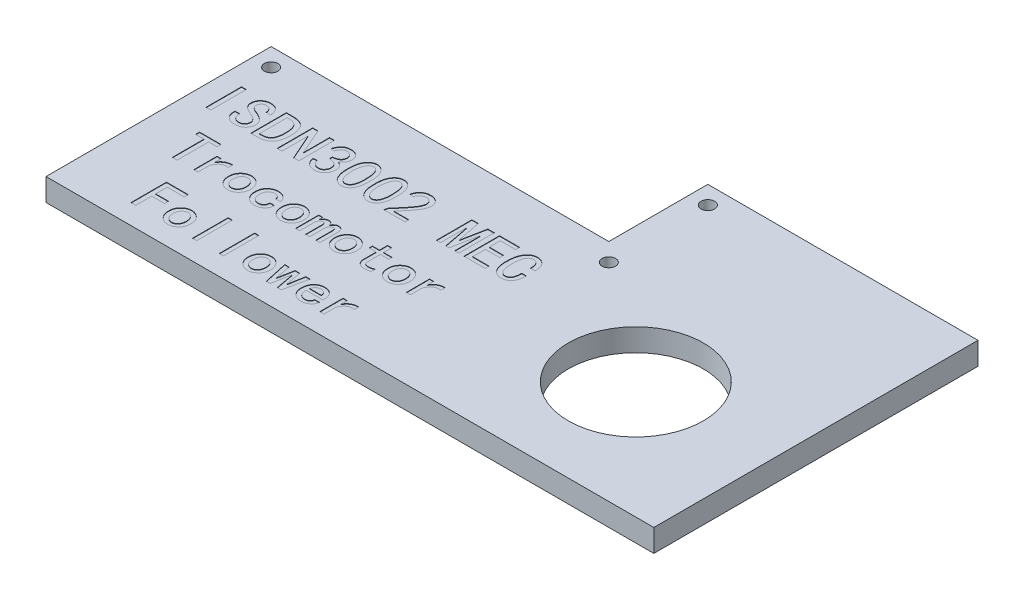
from build123d import *

# Parameters (mm, degrees)
SKETCH1_R           = 1.5
SKETCH1_R_2         = 15
BOSS_EXTRUDE1_DEPTH = 5
SKETCH2_W           = 1.060202953
SKETCH2_H           = 7.882378472
SKETCH2_W_2         = 0.92191561
CUT_EXTRUDE1_DEPTH  = 0.1


with BuildPart() as part:
    # Sketch1 → Boss-Extrude1 (new body)
    with BuildSketch(Plane(origin=(0, 0, 0), x_dir=(1, 0, 0), z_dir=(0, 1, 0))):
        Polygon((-41.5, -7), (33.5, -7), (33.5, 15), (93.5, 15), (93.5, -57), (-41.5, -57), align=None)
        with Locations((-37.5, -11)):
            Circle(SKETCH1_R, mode=Mode.SUBTRACT)
        with Locations((37.5, -11)):
            Circle(SKETCH1_R, mode=Mode.SUBTRACT)
        with Locations((37.5, 11)):
            Circle(SKETCH1_R, mode=Mode.SUBTRACT)
        with Locations((63.5, -31)):
            Circle(SKETCH1_R_2, mode=Mode.SUBTRACT)
    extrude(amount=BOSS_EXTRUDE1_DEPTH)

    # Sketch2 → Cut-Extrude1 (cut)
    # profile 1 of 29: a face of its own
    with BuildSketch(Plane(origin=(0, 5, 0), x_dir=(1, 0, 0), z_dir=(0, 1, 0))):
        with BuildLine():
            add(Edge.make_bspline(
                [(-9.485397884, -21.460778513), (-9.481008359, -21.361711719), (-9.472446973, -21.168490589), (-9.447711357, -20.886752386), (-9.417840582, -20.620110914), (-9.379004627, -20.369381621), (-9.331005346, -20.13539906), (-9.276676056, -19.916936968), (-9.213890002, -19.714606603), (-9.12143886, -19.467501982), (-8.982803962, -19.183087555), (-8.784501906, -18.870495721), (-8.554068331, -18.589497645), (-8.336070838, -18.383601161), (-8.147052264, -18.238690255), (-7.996030026, -18.144604296), (-7.837366889, -18.064214927), (-7.670542531, -17.998655708), (-7.495863728, -17.949820406), (-7.313793256, -17.913765816), (-7.123730211, -17.891461898), (-6.927879602, -17.884826207), (-6.730553226, -17.894117382), (-6.536708321, -17.924385415), (-6.349651371, -17.978118909), (-6.16925465, -18.051886512), (-5.996009106, -18.146668739), (-5.829042659, -18.261704247), (-5.670334748, -18.399968), (-5.517907332, -18.55584582), (-5.375535666, -18.727401767), (-5.245123536, -18.911324932), (-5.127212676, -19.105718178), (-5.023374739, -19.311647957), (-4.93029636, -19.52729841), (-4.852211875, -19.754590396), (-4.78761043, -19.992600499), (-4.716474122, -20.328831519), (-4.653889593, -20.774833265), (-4.609798003, -21.339300947), (-4.599736978, -21.941181601), (-4.614718019, -22.46168514), (-4.642957628, -22.883413084), (-4.675062941, -23.189297613), (-4.718185945, -23.47959408), (-4.768386253, -23.755715522), (-4.831189876, -24.016193516), (-4.905612842, -24.261307158), (-4.98602352, -24.492657703), (-5.080671229, -24.707813304), (-5.183757437, -24.908601168), (-5.301284527, -25.092449294), (-5.428608722, -25.26184097), (-5.569105225, -25.41543383), (-5.724604505, -25.5501339), (-5.8896965, -25.672440958), (-6.068814888, -25.776538037), (-6.257186658, -25.864874549), (-6.451195399, -25.935179154), (-6.648419013, -25.981001616), (-6.845136977, -26.008236642), (-7.042735543, -26.008336279), (-7.240043977, -25.991155988), (-7.436251978, -25.945962262), (-7.633779722, -25.883825781), (-7.827336348, -25.795953026), (-8.013630032, -25.694771961), (-8.188982055, -25.585870735), (-8.34860028, -25.467370584), (-8.493760075, -25.340822186), (-8.626272262, -25.207288058), (-8.744573, -25.065500517), (-8.847434389, -24.915066962), (-8.962380119, -24.703351746), (-9.085523706, -24.430264766), (-9.212976633, -24.093887201), (-9.317144351, -23.749418494), (-9.384126315, -23.453398693), (-9.42828743, -23.205755488), (-9.452584955, -23.002749712), (-9.473691009, -22.78422197), (-9.486446903, -22.550121354), (-9.494931721, -22.300244896), (-9.498624456, -22.03441459), (-9.494672028, -21.752661363), (-9.488543844, -21.559790515), (-9.485397884, -21.460778513)],
                knots=[0, 0, 0, 0, 1.18043416, 2.302333746, 3.366253517, 4.374302266, 5.321670991, 6.208995316, 7.053297808, 7.84229274, 9.348259463, 10.810477328, 12.240076564, 13.663562249, 14.3695339, 15.072606272, 15.778577923, 16.484387009, 17.202829605, 17.934942377, 18.692112664, 19.478485278, 20.265441384, 21.040673806, 21.808439453, 22.577161074, 23.356320991, 24.155029842, 24.986154494, 25.858111265, 26.748121484, 27.637306138, 28.540117759, 29.452135788, 30.380885827, 31.334339875, 32.310628684, 33.31521083, 35.42407972, 37.666773946, 40.052062172, 42.587025658, 43.863776122, 45.083322308, 46.247467896, 47.357025429, 48.423487632, 49.435172604, 50.405897663, 51.337337341, 52.231284254, 53.090220275, 53.931690991, 54.751583713, 55.562922169, 56.377338113, 57.194202079, 58.024663732, 58.851830165, 59.645552351, 60.431282623, 61.21044254, 61.99312915, 62.783838437, 63.60230231, 64.454612977, 65.309477934, 66.125301685, 66.909862715, 67.67340185, 68.415973016, 69.147238889, 69.868837108, 70.581506411, 72.0124375, 73.431838244, 74.861437481, 76.292961888, 77.042577341, 77.855187732, 78.726196438, 79.655959089, 80.645695907, 81.702690171, 82.820655125, 84, 84, 84, 84], degree=3))
        make_face()
        with BuildLine():
            add(Edge.make_bspline(
                [(-8.517386493, -21.18420383), (-8.527851702, -21.288279438), (-8.548468527, -21.493312007), (-8.565330596, -21.797473818), (-8.570135829, -22.093025465), (-8.565735544, -22.38008645), (-8.548765948, -22.658095119), (-8.51981295, -22.927589474), (-8.478570264, -23.188380356), (-8.428092861, -23.43977618), (-8.367613978, -23.677758867), (-8.295890876, -23.89909507), (-8.214252721, -24.102172399), (-8.123941736, -24.287296761), (-8.024807879, -24.454689154), (-7.915005165, -24.603399037), (-7.797614221, -24.736589974), (-7.669126783, -24.848521193), (-7.537344223, -24.942519256), (-7.402611236, -25.015554871), (-7.267125232, -25.067307947), (-7.130369089, -25.098952017), (-6.992835734, -25.109055768), (-6.854470331, -25.099268821), (-6.716296374, -25.065109802), (-6.579000192, -25.012756313), (-6.446520863, -24.94064908), (-6.321190783, -24.853579233), (-6.205623121, -24.749599194), (-6.099756777, -24.629825077), (-6.004197116, -24.493515998), (-5.916761739, -24.343002289), (-5.839986834, -24.17578747), (-5.749706155, -23.930955158), (-5.65878489, -23.604904113), (-5.577894709, -23.197475491), (-5.530183698, -22.772580542), (-5.517674371, -22.336638449), (-5.525807926, -21.9034761), (-5.5355631, -21.48386167), (-5.559019774, -21.084885274), (-5.587092755, -20.704515303), (-5.634735226, -20.341053511), (-5.722533954, -19.996403609), (-5.845514196, -19.669631048), (-5.971740088, -19.411677388), (-6.092711432, -19.224432077), (-6.188075979, -19.098795857), (-6.294097026, -18.993811737), (-6.40589007, -18.904312147), (-6.526055678, -18.836174254), (-6.653507131, -18.785205496), (-6.788188775, -18.75361975), (-6.928059552, -18.738045423), (-7.068974564, -18.740768026), (-7.207387122, -18.765501252), (-7.341633286, -18.808756237), (-7.472557758, -18.870334964), (-7.597413619, -18.953680079), (-7.718196623, -19.055686725), (-7.833546056, -19.178072601), (-7.947172675, -19.317516143), (-8.050819924, -19.479437298), (-8.146675315, -19.660819419), (-8.231681205, -19.863992992), (-8.307812771, -20.087782105), (-8.376186256, -20.33217461), (-8.433674602, -20.597317532), (-8.481379772, -20.883422202), (-8.50511067, -21.081657916), (-8.517386493, -21.18420383)],
                knots=[0, 0, 0, 0, 1.378198314, 2.715098627, 4.012594964, 5.272602849, 6.497213731, 7.681415101, 8.842769074, 9.975170128, 11.059162755, 12.076494648, 13.038717388, 13.940857576, 14.788360499, 15.598271168, 16.373595835, 17.122768248, 17.838466736, 18.502782022, 19.136468245, 19.744060339, 20.345653328, 20.947246317, 21.563841626, 22.214212994, 22.87852828, 23.546305104, 24.220743313, 24.921956094, 25.648106704, 26.41081768, 27.212668989, 28.069279432, 29.84713992, 31.666334073, 33.537864714, 35.473745168, 37.408579624, 39.246547954, 41.003985019, 42.674193204, 44.272363647, 45.827394737, 47.348405091, 48.867584295, 49.599750274, 50.283750763, 50.94125936, 51.560811542, 52.165388272, 52.754418158, 53.363720025, 53.982318455, 54.604903792, 55.213928724, 55.828148287, 56.458765578, 57.113918044, 57.800421407, 58.537638978, 59.326979919, 60.167286366, 61.066273245, 62.027297208, 63.065989643, 64.179487018, 65.369443928, 66.639232213, 68, 68, 68, 68], degree=3))
        make_face(mode=Mode.SUBTRACT)
    # profile 2 of 29: a face of its own
    with BuildSketch(Plane(origin=(0, 5, 0), x_dir=(1, 0, 0), z_dir=(0, 1, 0))):
        with BuildLine():
            add(Edge.make_bspline(
                [(-3.585137975, -21.460778513), (-3.58074845, -21.361711719), (-3.572187064, -21.168490589), (-3.547451447, -20.886752386), (-3.517580673, -20.620110914), (-3.478744718, -20.369381621), (-3.430745437, -20.13539906), (-3.376416147, -19.916936968), (-3.313630093, -19.714606603), (-3.221178951, -19.467501982), (-3.082544053, -19.183087555), (-2.884241997, -18.870495721), (-2.653808422, -18.589497645), (-2.435810929, -18.383601161), (-2.246792355, -18.238690255), (-2.095770117, -18.144604296), (-1.93710698, -18.064214927), (-1.770282622, -17.998655708), (-1.595603819, -17.949820406), (-1.413533347, -17.913765816), (-1.223470302, -17.891461898), (-1.027619693, -17.884826207), (-0.830293317, -17.894117382), (-0.636448412, -17.924385415), (-0.449391462, -17.978118909), (-0.268994741, -18.051886512), (-0.095749197, -18.146668739), (0.07121725, -18.261704247), (0.229925161, -18.399968), (0.382352577, -18.55584582), (0.524724243, -18.727401767), (0.655136373, -18.911324932), (0.773047233, -19.105718178), (0.87688517, -19.311647957), (0.969963549, -19.52729841), (1.048048034, -19.754590396), (1.112649479, -19.992600499), (1.183785787, -20.328831519), (1.246370316, -20.774833265), (1.290461906, -21.339300947), (1.300522931, -21.941181601), (1.28554189, -22.46168514), (1.257302281, -22.883413084), (1.225196968, -23.189297613), (1.182073964, -23.47959408), (1.131873656, -23.755715522), (1.069070033, -24.016193516), (0.994647067, -24.261307158), (0.914236389, -24.492657703), (0.819588681, -24.707813304), (0.716502472, -24.908601168), (0.598975382, -25.092449294), (0.471651187, -25.26184097), (0.331154684, -25.41543383), (0.175655404, -25.5501339), (0.010563409, -25.672440958), (-0.168554979, -25.776538037), (-0.356926749, -25.864874549), (-0.55093549, -25.935179154), (-0.748159104, -25.981001616), (-0.944877068, -26.008236642), (-1.142475634, -26.008336279), (-1.339784068, -25.991155988), (-1.535992069, -25.945962262), (-1.733519813, -25.883825781), (-1.927076439, -25.795953026), (-2.113370123, -25.694771961), (-2.288722146, -25.585870735), (-2.448340371, -25.467370584), (-2.593500166, -25.340822186), (-2.726012353, -25.207288058), (-2.844313091, -25.065500517), (-2.94717448, -24.915066962), (-3.062120209, -24.703351746), (-3.185263797, -24.430264766), (-3.312716724, -24.093887201), (-3.416884442, -23.749418494), (-3.483866406, -23.453398693), (-3.528027521, -23.205755488), (-3.552325046, -23.002749712), (-3.5734311, -22.78422197), (-3.586186994, -22.550121354), (-3.594671812, -22.300244896), (-3.598364547, -22.03441459), (-3.594412119, -21.752661363), (-3.588283935, -21.559790515), (-3.585137975, -21.460778513)],
                knots=[0, 0, 0, 0, 1.18043416, 2.302333746, 3.366253517, 4.374302266, 5.321670991, 6.208995316, 7.053297808, 7.84229274, 9.348259463, 10.810477328, 12.240076564, 13.663562249, 14.3695339, 15.072606272, 15.778577923, 16.484387009, 17.202829605, 17.934942377, 18.692112664, 19.478485278, 20.265441384, 21.040673806, 21.808439453, 22.577161074, 23.356320991, 24.155029842, 24.986154494, 25.858111265, 26.748121484, 27.637306138, 28.540117759, 29.452135788, 30.380885827, 31.334339875, 32.310628684, 33.31521083, 35.42407972, 37.666773946, 40.052062172, 42.587025658, 43.863776122, 45.083322308, 46.247467896, 47.357025429, 48.423487632, 49.435172604, 50.405897663, 51.337337341, 52.231284254, 53.090220275, 53.931690991, 54.751583713, 55.562922169, 56.377338113, 57.194202079, 58.024663732, 58.851830165, 59.645552351, 60.431282623, 61.21044254, 61.99312915, 62.783838437, 63.60230231, 64.454612977, 65.309477934, 66.125301685, 66.909862715, 67.67340185, 68.415973016, 69.147238889, 69.868837108, 70.581506411, 72.0124375, 73.431838244, 74.861437481, 76.292961888, 77.042577341, 77.855187732, 78.726196438, 79.655959089, 80.645695907, 81.702690171, 82.820655125, 84, 84, 84, 84], degree=3))
        make_face()
        with BuildLine():
            add(Edge.make_bspline(
                [(-2.617126584, -21.18420383), (-2.627591793, -21.288279438), (-2.648208618, -21.493312007), (-2.665070687, -21.797473818), (-2.66987592, -22.093025465), (-2.665475635, -22.38008645), (-2.648506039, -22.658095119), (-2.619553041, -22.927589474), (-2.578310355, -23.188380356), (-2.527832952, -23.43977618), (-2.467354069, -23.677758867), (-2.395630967, -23.89909507), (-2.313992812, -24.102172399), (-2.223681827, -24.287296761), (-2.12454797, -24.454689154), (-2.014745256, -24.603399037), (-1.897354312, -24.736589974), (-1.768866874, -24.848521193), (-1.637084314, -24.942519256), (-1.502351327, -25.015554871), (-1.366865323, -25.067307947), (-1.23010918, -25.098952017), (-1.092575825, -25.109055768), (-0.954210422, -25.099268821), (-0.816036465, -25.065109802), (-0.678740283, -25.012756313), (-0.546260954, -24.94064908), (-0.420930874, -24.853579233), (-0.305363212, -24.749599194), (-0.199496868, -24.629825077), (-0.103937207, -24.493515998), (-0.01650183, -24.343002289), (0.060273075, -24.17578747), (0.150553754, -23.930955158), (0.241475019, -23.604904113), (0.3223652, -23.197475491), (0.370076211, -22.772580542), (0.382585538, -22.336638449), (0.374451983, -21.9034761), (0.364696809, -21.48386167), (0.341240135, -21.084885274), (0.313167154, -20.704515303), (0.265524683, -20.341053511), (0.177725955, -19.996403609), (0.054745713, -19.669631048), (-0.071480179, -19.411677388), (-0.192451523, -19.224432077), (-0.28781607, -19.098795857), (-0.393837117, -18.993811737), (-0.505630161, -18.904312147), (-0.625795769, -18.836174254), (-0.753247222, -18.785205496), (-0.887928866, -18.75361975), (-1.027799643, -18.738045423), (-1.168714655, -18.740768026), (-1.307127213, -18.765501252), (-1.441373377, -18.808756237), (-1.572297849, -18.870334964), (-1.69715371, -18.953680079), (-1.817936713, -19.055686725), (-1.933286147, -19.178072601), (-2.046912766, -19.317516143), (-2.150560015, -19.479437298), (-2.246415406, -19.660819419), (-2.331421296, -19.863992992), (-2.407552862, -20.087782105), (-2.475926347, -20.33217461), (-2.533414693, -20.597317532), (-2.581119862, -20.883422202), (-2.604850761, -21.081657916), (-2.617126584, -21.18420383)],
                knots=[0, 0, 0, 0, 1.378198314, 2.715098627, 4.012594964, 5.272602849, 6.497213731, 7.681415101, 8.842769074, 9.975170128, 11.059162755, 12.076494648, 13.038717388, 13.940857576, 14.788360499, 15.598271168, 16.373595835, 17.122768248, 17.838466736, 18.502782022, 19.136468245, 19.744060339, 20.345653328, 20.947246317, 21.563841626, 22.214212994, 22.87852828, 23.546305104, 24.220743313, 24.921956094, 25.648106704, 26.41081768, 27.212668989, 28.069279432, 29.84713992, 31.666334073, 33.537864714, 35.473745168, 37.408579624, 39.246547954, 41.003985019, 42.674193204, 44.272363647, 45.827394737, 47.348405091, 48.867584295, 49.599750274, 50.283750763, 50.94125936, 51.560811542, 52.165388272, 52.754418158, 53.363720025, 53.982318455, 54.604903792, 55.213928724, 55.828148287, 56.458765578, 57.113918044, 57.800421407, 58.537638978, 59.326979919, 60.167286366, 61.066273245, 62.027297208, 63.065989643, 64.179487018, 65.369443928, 66.639232213, 68, 68, 68, 68], degree=3))
        make_face(mode=Mode.SUBTRACT)
    # profile 3 of 29: a face of its own
    with BuildSketch(Plane(origin=(0, 5, 0), x_dir=(1, 0, 0), z_dir=(0, 1, 0))):
        with Locations((-36.520573171, -21.966978473)):
            Rectangle(SKETCH2_W, SKETCH2_H)
    # profile 4 of 29: a face of its own
    with BuildSketch(Plane(origin=(0, 5, 0), x_dir=(1, 0, 0), z_dir=(0, 1, 0))):
        with BuildLine():
            add(Edge.make_bspline(
                [(-28.154189003, -23.695570243), (-28.156084715, -23.781592558), (-28.159788444, -23.94965781), (-28.190850936, -24.195595824), (-28.243396818, -24.427796872), (-28.317123967, -24.646414307), (-28.411373108, -24.850873804), (-28.526827591, -25.042258315), (-28.66345447, -25.220042624), (-28.820993739, -25.38199992), (-28.995391878, -25.527562284), (-29.186121863, -25.654336691), (-29.391770805, -25.762702422), (-29.613716645, -25.849298849), (-29.849601959, -25.91792427), (-30.101212767, -25.965006065), (-30.367224363, -25.994435542), (-30.549952132, -25.998355446), (-30.643361152, -26.00035927)],
                knots=[0, 0, 0, 0, 1.076144108, 2.102505996, 3.095825232, 4.050645424, 4.984196986, 5.907479825, 6.841845839, 7.783590996, 8.729097989, 9.679099523, 10.644246964, 11.632062862, 12.655232941, 13.713869879, 14.831347993, 16, 16, 16, 16], degree=3))
            add(Edge.make_bspline(
                [(-30.643361152, -26.00035927), (-30.736790247, -25.99854639), (-30.919055222, -25.995009756), (-31.183846265, -25.963107386), (-31.434100745, -25.914956131), (-31.667552286, -25.842591928), (-31.886417334, -25.752944212), (-32.087221941, -25.639798042), (-32.275603243, -25.511158167), (-32.442523989, -25.357627736), (-32.595688811, -25.193686455), (-32.724606359, -25.014337825), (-32.837441085, -24.827901654), (-32.927470395, -24.629849814), (-33.000691151, -24.422904563), (-33.048635468, -24.204332756), (-33.081005775, -23.976526879), (-33.084605355, -23.820886205), (-33.08643752, -23.741666024)],
                knots=[0, 0, 0, 0, 1.196538468, 2.33425201, 3.412396666, 4.457161548, 5.460527637, 6.436390177, 7.405227411, 8.375846278, 9.335670364, 10.274835003, 11.200142775, 12.12337999, 13.057237208, 14.007039654, 14.985594985, 16, 16, 16, 16], degree=3))
            Line((-33.08643752, -23.741666024), (-33.08643752, -23.41899556))
            Line((-33.08643752, -23.41899556), (-32.026234568, -23.41899556))
            Line((-32.026234568, -23.41899556), (-32.026234568, -23.695570243))
            add(Edge.make_bspline(
                [(-32.026234568, -23.695570243), (-32.024807709, -23.751386342), (-32.022018486, -23.860495634), (-32.003736472, -24.018958007), (-31.971083738, -24.167683082), (-31.925295109, -24.305599809), (-31.866685055, -24.434084759), (-31.794693208, -24.551839914), (-31.710689237, -24.660843622), (-31.581495426, -24.788523186), (-31.401139104, -24.920528744), (-31.165611149, -25.04068182), (-30.909627766, -25.110503243), (-30.733118524, -25.119807896), (-30.643361152, -25.12453944)],
                knots=[0, 0, 0, 0, 0.899937149, 1.759196843, 2.567308812, 3.350717544, 4.097934817, 4.839099816, 5.571408796, 6.31103876, 7.760779786, 9.155922253, 10.553747428, 12, 12, 12, 12], degree=3))
            add(Edge.make_bspline(
                [(-30.643361152, -25.12453944), (-30.584148998, -25.122951781), (-30.468892484, -25.1198614), (-30.301871843, -25.103996553), (-30.147115997, -25.072796228), (-30.005017906, -25.030758518), (-29.874679112, -24.975669464), (-29.757572842, -24.907418568), (-29.650882542, -24.828374795), (-29.530009484, -24.704819432), (-29.402626044, -24.532764898), (-29.294209262, -24.301635799), (-29.226483529, -24.051065035), (-29.218488879, -23.876975443), (-29.214391955, -23.787761805)],
                knots=[0, 0, 0, 0, 0.962219836, 1.872961855, 2.721515218, 3.522926727, 4.276799653, 5.014164922, 5.72050659, 6.426545665, 7.815246758, 9.175842648, 10.55273742, 12, 12, 12, 12], degree=3))
            add(Edge.make_bspline(
                [(-29.214391955, -23.787761805), (-29.21580477, -23.749555589), (-29.218605245, -23.673823441), (-29.23819068, -23.56092354), (-29.270257973, -23.45015348), (-29.317096752, -23.342320396), (-29.376211061, -23.236671778), (-29.4476528, -23.133224478), (-29.532289033, -23.031614649), (-29.665878441, -22.896593516), (-29.865563707, -22.733902642), (-30.143282611, -22.54969299), (-30.467967676, -22.375716498), (-30.703983447, -22.273896928), (-30.827744274, -22.220505266)],
                knots=[0, 0, 0, 0, 0.578251208, 1.146206319, 1.729632852, 2.320140678, 2.921792905, 3.559846951, 4.220588567, 4.921185791, 6.432399352, 8.109791427, 9.960070942, 12, 12, 12, 12], degree=3))
            add(Edge.make_bspline(
                [(-30.827744274, -22.220505266), (-30.916751796, -22.185788962), (-31.089584422, -22.118377692), (-31.337586291, -22.010824123), (-31.566531346, -21.900720842), (-31.774992415, -21.785616368), (-31.96530347, -21.670558324), (-32.135266316, -21.550652089), (-32.285450035, -21.42757009), (-32.419202143, -21.303150848), (-32.532002582, -21.171130066), (-32.63291344, -21.036940549), (-32.714115572, -20.89370249), (-32.783283626, -20.746854144), (-32.836876324, -20.593566521), (-32.873328213, -20.434307736), (-32.899288795, -20.269392415), (-32.901123024, -20.157112302), (-32.902054398, -20.100099361)],
                knots=[0, 0, 0, 0, 1.442788407, 2.80157118, 4.081608732, 5.277882525, 6.396683758, 7.438774622, 8.41600694, 9.327939604, 10.193066353, 11.035393571, 11.859457263, 12.674643564, 13.484648255, 14.306018334, 15.139839872, 16, 16, 16, 16], degree=3))
            add(Edge.make_bspline(
                [(-32.902054398, -20.100099361), (-32.900115027, -20.021472451), (-32.896305204, -19.867012802), (-32.865503647, -19.64083873), (-32.812310815, -19.426385434), (-32.738839074, -19.223587445), (-32.643929635, -19.032580892), (-32.52921571, -18.852628962), (-32.393423792, -18.683810547), (-32.236732565, -18.530379601), (-32.066451054, -18.391260409), (-31.887594943, -18.267164422), (-31.698752972, -18.164826858), (-31.502574171, -18.080873694), (-31.299599037, -18.01322062), (-31.087609658, -17.96844826), (-30.868505498, -17.937312442), (-30.719162949, -17.934848367), (-30.643361152, -17.933597676)],
                knots=[0, 0, 0, 0, 1.07870255, 2.119071136, 3.124805643, 4.105581286, 5.072990272, 6.045680189, 7.028691787, 8.039235481, 9.049145311, 10.043383937, 11.021887354, 11.990902522, 12.968844852, 13.952259623, 14.960628413, 16, 16, 16, 16], degree=3))
            add(Edge.make_bspline(
                [(-30.643361152, -17.933597676), (-30.547112065, -17.936116044), (-30.360307982, -17.941003793), (-30.090650556, -17.972100215), (-29.84197388, -18.02922334), (-29.613905778, -18.106585969), (-29.40665457, -18.208817833), (-29.219137777, -18.330817875), (-29.054893276, -18.478941498), (-28.912516644, -18.646369697), (-28.790524921, -18.826580367), (-28.681608946, -19.010493923), (-28.588725737, -19.197687013), (-28.515669195, -19.390275314), (-28.457454252, -19.585413403), (-28.413556254, -19.784312684), (-28.390211396, -19.987425745), (-28.38651719, -20.123948772), (-28.384667905, -20.192290922)],
                knots=[0, 0, 0, 0, 1.282260702, 2.488662931, 3.608602347, 4.675455947, 5.689164954, 6.679473553, 7.645844993, 8.624331637, 9.600024491, 10.541331786, 11.470286479, 12.379766298, 13.281599694, 14.181168015, 15.089509718, 16, 16, 16, 16], degree=3))
            Line((-28.384667905, -20.192290922), (-29.444870858, -20.192290922))
            add(Edge.make_bspline(
                [(-29.444870858, -20.192290922), (-29.441541498, -20.109607366), (-29.43496089, -19.946180169), (-29.483438926, -19.70486971), (-29.578403441, -19.476652043), (-29.692598873, -19.300661605), (-29.803914527, -19.171953137), (-29.89907986, -19.087715443), (-30.001405419, -19.01573797), (-30.113101242, -18.956352154), (-30.233663361, -18.910974737), (-30.363062052, -18.878252262), (-30.500548609, -18.859651643), (-30.594933403, -18.856916604), (-30.643361152, -18.855513287)],
                knots=[0, 0, 0, 0, 1.460207937, 2.886156602, 4.313065059, 5.813047609, 6.57660706, 7.318406664, 8.055956018, 8.78576476, 9.550717507, 10.329856714, 11.143068759, 12, 12, 12, 12], degree=3))
            add(Edge.make_bspline(
                [(-30.643361152, -18.855513287), (-30.731353872, -18.858670528), (-30.899106149, -18.8646896), (-31.136503085, -18.922409955), (-31.345846426, -19.016389697), (-31.523158501, -19.149605265), (-31.667356464, -19.312742938), (-31.770370661, -19.506103584), (-31.830918827, -19.726034699), (-31.838112663, -19.881179903), (-31.841851446, -19.96181202)],
                knots=[0, 0, 0, 0, 1.145558682, 2.183931547, 3.163371772, 4.117557764, 5.053569339, 5.979736134, 6.950027789, 8, 8, 8, 8], degree=3))
            add(Edge.make_bspline(
                [(-31.841851446, -19.96181202), (-31.839220427, -20.028710052), (-31.834066161, -20.159765811), (-31.783902038, -20.348710012), (-31.70482587, -20.523644443), (-31.610821734, -20.659073103), (-31.508842973, -20.760165736), (-31.40662025, -20.840294077), (-31.279438533, -20.923403839), (-31.127018238, -21.010218677), (-30.948949188, -21.099432125), (-30.747818647, -21.196078674), (-30.519638016, -21.292273619), (-30.358915936, -21.356884071), (-30.274594907, -21.390781216)],
                knots=[0, 0, 0, 0, 1.054277047, 2.065368358, 3.062471884, 4.074520743, 4.646282749, 5.323992781, 6.121378042, 7.042966294, 8.091677809, 9.265162139, 10.56519814, 12, 12, 12, 12], degree=3))
            add(Edge.make_bspline(
                [(-30.274594907, -21.390781216), (-30.192369383, -21.425429705), (-30.031088841, -21.493390683), (-29.798261149, -21.604277634), (-29.580681097, -21.722161491), (-29.376552927, -21.842872579), (-29.188149439, -21.969785748), (-29.013609325, -22.101261914), (-28.852803784, -22.237437795), (-28.707104789, -22.37931839), (-28.577574901, -22.525940465), (-28.462679706, -22.676339682), (-28.369528197, -22.834968105), (-28.289789428, -22.996361343), (-28.230127055, -23.164535109), (-28.185156509, -23.336233209), (-28.158994784, -23.514367902), (-28.155806179, -23.634594476), (-28.154189003, -23.695570243)],
                knots=[0, 0, 0, 0, 1.286245445, 2.522894961, 3.715884829, 4.852742623, 5.94040206, 6.988895921, 8.001566966, 8.976237793, 9.917821146, 10.82027623, 11.699651049, 12.565605398, 13.411626584, 14.267259483, 15.121199423, 16, 16, 16, 16], degree=3))
        make_face()
    # profile 5 of 29: a face of its own
    with BuildSketch(Plane(origin=(0, 5, 0), x_dir=(1, 0, 0), z_dir=(0, 1, 0))):
        with BuildLine():
            add(Edge.make_bspline(
                [(-22.207833313, -21.990026363), (-22.210069739, -22.160286895), (-22.214385716, -22.488864877), (-22.258091623, -22.96277061), (-22.325778987, -23.399290167), (-22.424712467, -23.797563274), (-22.550424963, -24.158277526), (-22.703289834, -24.482066275), (-22.886944527, -24.767468296), (-23.100799945, -25.012771247), (-23.337661874, -25.22430596), (-23.593238088, -25.407444966), (-23.867073182, -25.564501644), (-24.162539646, -25.688434317), (-24.475340076, -25.788472261), (-24.808991708, -25.857157268), (-25.161327152, -25.901289328), (-25.403100029, -25.905840492), (-25.526729512, -25.908167709)],
                knots=[0, 0, 0, 0, 1.389524785, 2.681580087, 3.881416849, 4.992360851, 6.026729756, 6.995017906, 7.908603538, 8.787894915, 9.643211222, 10.495393011, 11.350494818, 12.214247491, 13.106065295, 14.027214329, 14.991224842, 16, 16, 16, 16], degree=3))
            Line((-25.526729512, -25.908167709), (-27.09398605, -25.908167709))
            Line((-27.09398605, -25.908167709), (-27.09398605, -18.025789237))
            Line((-27.09398605, -18.025789237), (-25.526729512, -18.025789237))
            add(Edge.make_bspline(
                [(-25.526729512, -18.025789237), (-25.388869302, -18.027885003), (-25.122050788, -18.031941207), (-24.736732892, -18.077945771), (-24.379164864, -18.148090207), (-24.049417042, -18.248852143), (-23.746810626, -18.378010897), (-23.47340922, -18.538418548), (-23.225919863, -18.724869748), (-23.008686611, -18.945349634), (-22.816617905, -19.197741846), (-22.652607769, -19.4875549), (-22.515672548, -19.814224635), (-22.400286668, -20.176684824), (-22.315616998, -20.57786959), (-22.253589972, -21.015336488), (-22.213019666, -21.490182783), (-22.209605662, -21.819213173), (-22.207833313, -21.990026363)],
                knots=[0, 0, 0, 0, 1.107739609, 2.143950281, 3.114742919, 4.033667788, 4.910720376, 5.753428295, 6.576026955, 7.394480551, 8.23354201, 9.118765776, 10.063698003, 11.076506874, 12.172173314, 13.355526632, 14.627145244, 16, 16, 16, 16], degree=3))
        make_face()
        with BuildLine():
            add(Edge.make_bspline(
                [(-23.314132046, -21.990026363), (-23.315709198, -21.85341259), (-23.318748225, -21.590170422), (-23.343546326, -21.210434623), (-23.388307903, -20.862362657), (-23.445750994, -20.544993454), (-23.524791947, -20.260949608), (-23.617320102, -20.007039471), (-23.730184452, -19.785096154), (-23.860882787, -19.592627778), (-24.010170757, -19.428335231), (-24.175902549, -19.286520493), (-24.359203146, -19.167182824), (-24.559552635, -19.068340737), (-24.777458403, -18.994508731), (-25.011690301, -18.939262862), (-25.263465405, -18.906744555), (-25.437287505, -18.903353811), (-25.526729512, -18.901609067)],
                knots=[0, 0, 0, 0, 1.50261862, 2.895407767, 4.182685949, 5.361245188, 6.439488336, 7.421939034, 8.328969596, 9.171036484, 9.973163414, 10.763455177, 11.563821661, 12.37285522, 13.214177287, 14.088724386, 15.01653284, 16, 16, 16, 16], degree=3))
            Line((-25.526729512, -18.901609067), (-26.033783098, -18.901609067))
            Line((-26.033783098, -18.901609067), (-26.033783098, -25.032347879))
            Line((-26.033783098, -25.032347879), (-25.526729512, -25.032347879))
            add(Edge.make_bspline(
                [(-25.526729512, -25.032347879), (-25.437303081, -25.030443403), (-25.263582323, -25.026743747), (-25.011792011, -24.996445036), (-24.777509689, -24.942920617), (-24.560022304, -24.870506648), (-24.359812556, -24.775272403), (-24.176119425, -24.66128465), (-24.010256386, -24.524622751), (-23.861582328, -24.365593146), (-23.729149857, -24.179299409), (-23.617513694, -23.961027173), (-23.524380166, -23.710183937), (-23.446034717, -23.428744191), (-23.388234868, -23.114312886), (-23.343354541, -22.768500047), (-23.318781669, -22.389879669), (-23.315720624, -22.126639237), (-23.314132046, -21.990026363)],
                knots=[0, 0, 0, 0, 0.9908866, 1.924907101, 2.80462885, 3.650254363, 4.45990781, 5.256111711, 6.040209073, 6.834462288, 7.662189065, 8.564851509, 9.54291023, 10.623211397, 11.798270521, 13.082748796, 14.486045376, 16, 16, 16, 16], degree=3))
        make_face(mode=Mode.SUBTRACT)
    # profile 6 of 29: a face of its own
    with BuildSketch(Plane(origin=(0, 5, 0), x_dir=(1, 0, 0), z_dir=(0, 1, 0))):
        Polygon((-16.445860746, -25.908167709), (-17.598255259, -25.908167709), (-20.133523189, -20.192290922), (-20.179618969, -20.192290922), (-20.179618969, -25.908167709), (-21.239821922, -25.908167709), (-21.239821922, -18.025789237), (-20.087427408, -18.025789237), (-17.552159479, -23.741666024), (-17.506063698, -23.741666024), (-17.506063698, -18.025789237), (-16.445860746, -18.025789237), align=None)
    # profile 7 of 29: a face of its own
    with BuildSketch(Plane(origin=(0, 5, 0), x_dir=(1, 0, 0), z_dir=(0, 1, 0))):
        with BuildLine():
            Line((-15.339562013, -23.879953366), (-14.509837963, -23.741666024))
            add(Edge.make_bspline(
                [(-14.509837963, -23.741666024), (-14.477131912, -23.838323256), (-14.412892817, -24.028171091), (-14.274088295, -24.290361524), (-14.10818237, -24.526933226), (-13.949014263, -24.704096558), (-13.805143442, -24.825077332), (-13.691669158, -24.904243944), (-13.572412817, -24.972159287), (-13.444012885, -25.021988418), (-13.311202959, -25.064867519), (-13.170399611, -25.088935769), (-13.024310543, -25.102686813), (-12.873993245, -25.105051994), (-12.724174484, -25.091355561), (-12.579486993, -25.063974489), (-12.4422207, -25.023497817), (-12.312948463, -24.966970691), (-12.193495689, -24.893723148), (-12.079261019, -24.810426099), (-11.974635676, -24.710287706), (-11.880620638, -24.596370433), (-11.795590571, -24.474089383), (-11.722106029, -24.346315415), (-11.661402529, -24.213904665), (-11.61605135, -24.076804124), (-11.58077942, -23.936000093), (-11.561314224, -23.79060336), (-11.551980376, -23.641018133), (-11.55809235, -23.489160169), (-11.573554615, -23.33921665), (-11.605141423, -23.195898124), (-11.647631882, -23.061732577), (-11.700373519, -22.934197305), (-11.769088527, -22.817679915), (-11.848206815, -22.708695691), (-11.939417636, -22.608580565), (-12.044941317, -22.51789746), (-12.163703212, -22.433719618), (-12.298329385, -22.355986392), (-12.450708676, -22.287709282), (-12.617620809, -22.221890377), (-12.802478493, -22.166438759), (-13.002900938, -22.115429373), (-13.220519613, -22.070813231), (-13.371552287, -22.047944896), (-13.449635011, -22.036122144)],
                knots=[0, 0, 0, 0, 1.854799748, 3.643076762, 5.375778243, 7.105784308, 7.958514958, 8.791774595, 9.621744654, 10.44880128, 11.294076632, 12.157496915, 13.041787632, 13.96367637, 14.889223527, 15.774908308, 16.640004354, 17.48869958, 18.334228731, 19.185637365, 20.057465777, 20.961908388, 21.86984341, 22.765285775, 23.641349219, 24.5158806, 25.390105247, 26.279235462, 27.181837661, 28.114543598, 29.042174801, 29.921843334, 30.780091711, 31.601551697, 32.427634894, 33.235597725, 34.049381879, 34.886366892, 35.762920031, 36.695625967, 37.710569643, 38.799256358, 39.959035312, 41.220118669, 42.562822875, 44, 44, 44, 44], degree=3))
            Line((-13.449635011, -22.036122144), (-13.449635011, -21.436876997))
            add(Edge.make_bspline(
                [(-13.449635011, -21.436876997), (-13.371511529, -21.428900049), (-13.220285808, -21.413458858), (-13.002969087, -21.372557964), (-12.801710297, -21.326495137), (-12.617392854, -21.267967518), (-12.449401797, -21.199773668), (-12.297066286, -21.122287813), (-12.162262955, -21.032385607), (-12.044007929, -20.933049768), (-11.940598345, -20.825059913), (-11.853344107, -20.708436835), (-11.780590647, -20.584405017), (-11.723787914, -20.451896553), (-11.683733892, -20.311174303), (-11.654990093, -20.163305291), (-11.646506598, -20.007425427), (-11.649507889, -19.84697447), (-11.666678263, -19.68809634), (-11.703241502, -19.537532399), (-11.75471851, -19.398299492), (-11.820420732, -19.268965728), (-11.906301047, -19.153666579), (-12.005505209, -19.048661902), (-12.121162503, -18.956027147), (-12.250521366, -18.876467079), (-12.388972716, -18.811488377), (-12.530666835, -18.758581509), (-12.675594304, -18.726844141), (-12.821964829, -18.709621728), (-12.970979008, -18.706930764), (-13.121903867, -18.725515122), (-13.275203444, -18.758070323), (-13.429828869, -18.806925131), (-13.58365758, -18.875847108), (-13.727924117, -18.975379919), (-13.862833243, -19.100329484), (-13.993040756, -19.248358688), (-14.110346793, -19.425791706), (-14.223690444, -19.626142507), (-14.328248535, -19.852826589), (-14.387019565, -20.015386124), (-14.417646402, -20.100099361)],
                knots=[0, 0, 0, 0, 1.385117707, 2.68120955, 3.899080185, 5.026526245, 6.089471502, 7.095537128, 8.036926677, 8.942108935, 9.815771246, 10.669349366, 11.506404864, 12.347666396, 13.205663414, 14.084102859, 14.999917747, 15.954128211, 16.914501223, 17.813254747, 18.680661639, 19.529560311, 20.363114732, 21.208382436, 22.07252795, 22.96987783, 23.881720011, 24.767988279, 25.632833695, 26.492298631, 27.366018653, 28.255410494, 29.169296362, 30.128408489, 31.112431375, 32.1318401, 33.205217515, 34.351116983, 35.601710711, 36.950682265, 38.410935554, 40, 40, 40, 40], degree=3))
            Line((-14.417646402, -20.100099361), (-15.247370452, -19.96181202))
            add(Edge.make_bspline(
                [(-15.247370452, -19.96181202), (-15.199003462, -19.82830162), (-15.104756026, -19.568144576), (-14.92863819, -19.202322124), (-14.724241739, -18.872637115), (-14.532630646, -18.623812819), (-14.364332006, -18.445114189), (-14.224767479, -18.329921987), (-14.076821832, -18.225226528), (-13.916626765, -18.137631837), (-13.746082256, -18.06292366), (-13.564345982, -18.005772006), (-13.372560783, -17.961304715), (-13.172717974, -17.931131885), (-12.971350008, -17.915144108), (-12.773486977, -17.908645051), (-12.582015386, -17.918606731), (-12.396323966, -17.935551822), (-12.217922237, -17.969010186), (-12.045756313, -18.01281194), (-11.880905572, -18.071756386), (-11.721463052, -18.13904574), (-11.572483345, -18.219523369), (-11.432158843, -18.307657769), (-11.306581094, -18.409982544), (-11.18842068, -18.518149401), (-11.086979796, -18.64118321), (-10.993308103, -18.771663431), (-10.911631589, -18.912687892), (-10.843935288, -19.063591454), (-10.787390716, -19.219860687), (-10.745077831, -19.381702363), (-10.713509064, -19.546410196), (-10.698697653, -19.715644583), (-10.696964215, -19.887460215), (-10.709249512, -20.063241722), (-10.735209468, -20.242332649), (-10.773642947, -20.42427714), (-10.82895326, -20.606110575), (-10.908595241, -20.782955467), (-11.009820842, -20.953810847), (-11.132441406, -21.118927656), (-11.276263361, -21.278145593), (-11.443428746, -21.429465042), (-11.629897191, -21.577626993), (-11.76610591, -21.667267528), (-11.836282692, -21.71345168)],
                knots=[0, 0, 0, 0, 2.088435488, 4.069504719, 5.960900737, 7.786563479, 8.680771598, 9.566313178, 10.444341104, 11.343825986, 12.247587673, 13.179685867, 14.142420713, 15.141886465, 16.150152099, 17.113396579, 18.05212794, 18.969441419, 19.854666253, 20.719823891, 21.58047219, 22.428151748, 23.263500765, 24.069461113, 24.861911808, 25.643808195, 26.422154676, 27.202794716, 28.005617324, 28.815006474, 29.633397489, 30.44783822, 31.273903418, 32.097929155, 32.94366283, 33.799737089, 34.68784804, 35.604243899, 36.533818883, 37.478357806, 38.450549751, 39.450331118, 40.49965591, 41.60193164, 42.764479089, 44, 44, 44, 44], degree=3))
            add(Edge.make_bspline(
                [(-11.836282692, -21.71345168), (-11.733287627, -21.762197306), (-11.53165213, -21.857627591), (-11.262019126, -22.050692019), (-11.030551982, -22.27832884), (-10.870356806, -22.496210404), (-10.762102691, -22.686223551), (-10.697659674, -22.842402039), (-10.648393775, -23.009072805), (-10.612794172, -23.18562067), (-10.590199162, -23.372849549), (-10.584540491, -23.570954562), (-10.591150064, -23.780291947), (-10.613416317, -23.996443757), (-10.649011854, -24.21342888), (-10.706132105, -24.422352094), (-10.779176045, -24.620916193), (-10.870533089, -24.809487219), (-10.980951598, -24.98641797), (-11.111358648, -25.151347872), (-11.255939894, -25.307923809), (-11.419963249, -25.449473673), (-11.593743171, -25.578431308), (-11.776119588, -25.690151149), (-11.963808653, -25.784397736), (-12.157544559, -25.859975536), (-12.357187119, -25.916451678), (-12.562283472, -25.955460421), (-12.773553554, -25.978297872), (-12.988302104, -25.980730946), (-13.202494124, -25.967962672), (-13.411013855, -25.935939734), (-13.613241088, -25.893234692), (-13.807360208, -25.830000639), (-13.995590156, -25.754441826), (-14.174587876, -25.659403827), (-14.347323844, -25.550948865), (-14.512062226, -25.427413145), (-14.666317559, -25.287213122), (-14.806566944, -25.130821092), (-14.934112345, -24.960362502), (-15.041996985, -24.771972664), (-15.141444252, -24.571792402), (-15.221427957, -24.354278907), (-15.29148684, -24.123177004), (-15.323297803, -23.962237838), (-15.339562013, -23.879953366)],
                knots=[0, 0, 0, 0, 1.556863988, 3.047903747, 4.51274202, 5.983117829, 6.732724558, 7.500714565, 8.289161914, 9.10779992, 9.96267821, 10.866591561, 11.817204889, 12.826910154, 13.838355827, 14.822602624, 15.786048742, 16.729939345, 17.685039949, 18.633769323, 19.603521256, 20.596937443, 21.593797024, 22.562140776, 23.519904659, 24.464277043, 25.403497682, 26.355035653, 27.318261422, 28.307425488, 29.290655039, 30.251043242, 31.192037974, 32.115630974, 33.041191859, 33.964292232, 34.884727864, 35.830159304, 36.778345149, 37.732302073, 38.701115445, 39.685485474, 40.699027657, 41.756353326, 42.852875359, 44, 44, 44, 44], degree=3))
        make_face()
    # profile 8 of 29: a face of its own
    with BuildSketch(Plane(origin=(0, 5, 0), x_dir=(1, 0, 0), z_dir=(0, 1, 0))):
        with BuildLine():
            add(Edge.make_bspline(
                [(2.453409276, -25.677688807), (2.458985389, -25.620591315), (2.470068197, -25.507107157), (2.508984539, -25.340157153), (2.563742688, -25.177154765), (2.635783264, -25.018173071), (2.7247349, -24.863147638), (2.834147617, -24.715360687), (2.956326218, -24.568298549), (3.102441218, -24.429299363), (3.259985646, -24.281404033), (3.423167799, -24.112119424), (3.599916723, -23.927301649), (3.783070742, -23.719074438), (3.980363073, -23.494925772), (4.184204774, -23.248232854), (4.399464408, -22.983713953), (4.620101167, -22.706287214), (4.836317598, -22.427646106), (5.035567011, -22.157601325), (5.216768259, -21.905454141), (5.378459015, -21.670314369), (5.516330845, -21.449473144), (5.636059252, -21.246357508), (5.738219345, -21.06133475), (5.840165201, -20.840355993), (5.936381764, -20.585509377), (6.011825894, -20.295996168), (6.046108841, -20.028055619), (6.032631409, -19.781836199), (5.979706745, -19.557143578), (5.887238249, -19.353294837), (5.757472676, -19.169565906), (5.591567271, -19.012825367), (5.402455208, -18.883781278), (5.192006738, -18.797077281), (4.966828865, -18.753259194), (4.731251202, -18.757223571), (4.493797631, -18.799439891), (4.257243138, -18.872819395), (4.029202245, -18.986438526), (3.805795573, -19.128182642), (3.598807213, -19.310791908), (3.416875818, -19.535667718), (3.262109875, -19.801664512), (3.184896761, -19.998170732), (3.144845984, -20.100099361)],
                knots=[0, 0, 0, 0, 0.683264685, 1.358023177, 2.0380809, 2.730345762, 3.435487858, 4.164189287, 4.919895072, 5.711413948, 6.565494804, 7.49616148, 8.513531843, 9.613812574, 10.80147361, 12.073102873, 13.428218159, 14.866997124, 16.298560904, 17.632315587, 18.867297526, 20.000038836, 21.033387935, 21.969994494, 22.810824564, 23.551397478, 24.869445784, 26.052467085, 27.111050094, 28.075902372, 28.975949733, 29.847314516, 30.728213316, 31.639844513, 32.554273251, 33.442456201, 34.333871785, 35.270085163, 36.233696473, 37.201335111, 38.211692251, 39.261697588, 40.347896805, 41.485826765, 42.695887429, 44, 44, 44, 44], degree=3))
            Line((3.144845984, -20.100099361), (2.269026153, -19.96181202))
            add(Edge.make_bspline(
                [(2.269026153, -19.96181202), (2.299947937, -19.876078365), (2.360108294, -19.709277919), (2.463702322, -19.47176216), (2.570717392, -19.250665865), (2.684090861, -19.047453987), (2.806282306, -18.863577054), (2.93432802, -18.697247413), (3.068798545, -18.548487353), (3.210210859, -18.417470875), (3.35807934, -18.301973484), (3.51341944, -18.201810428), (3.674296928, -18.114315318), (3.841344644, -18.0400595), (4.014923306, -17.980216606), (4.195804703, -17.936698071), (4.382138754, -17.902936397), (4.509376169, -17.892690765), (4.57381518, -17.887501895)],
                knots=[0, 0, 0, 0, 1.318688324, 2.565594597, 3.747971738, 4.872722892, 5.930337296, 6.940181326, 7.908044283, 8.828858542, 9.726735078, 10.619953387, 11.500744836, 12.374616489, 13.262770363, 14.15366946, 15.064931369, 16, 16, 16, 16], degree=3))
            add(Edge.make_bspline(
                [(4.57381518, -17.887501895), (4.648880893, -17.881481349), (4.794869177, -17.869772553), (5.008843287, -17.867567964), (5.210776147, -17.881533846), (5.404240684, -17.908057584), (5.593245479, -17.954945404), (5.7826594, -18.024131879), (5.974273736, -18.117645075), (6.16777686, -18.232340104), (6.357455278, -18.372743279), (6.529179552, -18.549292657), (6.680719125, -18.758570062), (6.8161159, -18.995313656), (6.925403011, -19.26148493), (6.99112826, -19.557959547), (7.015229659, -19.879564048), (7.001986615, -20.163240724), (6.969727395, -20.403284708), (6.924528701, -20.595132263), (6.859389749, -20.794845966), (6.78269582, -21.005519083), (6.680854629, -21.222155668), (6.566225029, -21.449405993), (6.429146144, -21.683150038), (6.304748057, -21.88509329), (6.192042031, -22.053234004), (6.09764089, -22.190438022), (5.994512918, -22.33689695), (5.878760332, -22.490282126), (5.75651096, -22.654110467), (5.625010439, -22.826966775), (5.483114163, -23.007352458), (5.332463486, -23.197553768), (5.172378172, -23.397063482), (5.002135708, -23.604725419), (4.821783118, -23.820072582), (4.634126931, -24.046023124), (4.436882109, -24.280683195), (4.2298976, -24.52383169), (4.012489817, -24.774372951), (3.86525488, -24.945234066), (3.790186911, -25.032347879)],
                knots=[0, 0, 0, 0, 0.924262298, 1.797511285, 2.623724224, 3.407158757, 4.191620419, 5.009283641, 5.877881841, 6.805175164, 7.767818098, 8.765683208, 9.814991193, 10.931884262, 12.107176208, 13.332417047, 14.642951659, 16.055476784, 16.810263112, 17.613474593, 18.470705512, 19.388078144, 20.363412498, 21.406914204, 22.511682051, 23.688322701, 24.318011351, 24.996206783, 25.732766533, 26.516574724, 27.354866926, 28.242087009, 29.182574856, 30.172115786, 31.220563025, 32.322544456, 33.468316952, 34.668650042, 35.928027342, 37.231299145, 38.588373428, 40, 40, 40, 40], degree=3))
            Line((3.790186911, -25.032347879), (7.10908311, -25.032347879))
            Line((7.10908311, -25.032347879), (7.10908311, -25.862071929))
            Line((7.10908311, -25.862071929), (2.453409276, -25.862071929))
            Line((2.453409276, -25.862071929), (2.453409276, -25.677688807))
        make_face()
    # profile 9 of 29: a face of its own
    with BuildSketch(Plane(origin=(0, 5, 0), x_dir=(1, 0, 0), z_dir=(0, 1, 0))):
        Polygon((19.09398605, -25.908167709), (18.172070439, -25.908167709), (18.172070439, -20.284482484), (18.079878878, -20.284482484), (16.973580145, -25.908167709), (16.236047657, -25.908167709), (15.129748924, -20.284482484), (15.037557363, -20.284482484), (15.037557363, -25.908167709), (14.115641752, -25.908167709), (14.115641752, -18.025789237), (15.544610949, -18.025789237), (16.558718121, -23.234612438), (16.650909682, -23.234612438), (17.665016853, -18.025789237), (19.09398605, -18.025789237), align=None)
    # profile 10 of 29: a face of its own
    with BuildSketch(Plane(origin=(0, 5, 0), x_dir=(1, 0, 0), z_dir=(0, 1, 0))):
        Polygon((24.948150179, -25.908167709), (20.246380564, -25.908167709), (20.246380564, -18.025789237), (24.717671276, -18.025789237), (24.717671276, -18.901609067), (21.306583516, -18.901609067), (21.306583516, -21.344685436), (24.441096593, -21.344685436), (24.441096593, -22.220505266), (21.306583516, -22.220505266), (21.306583516, -25.032347879), (24.948150179, -25.032347879), align=None)
    # profile 11 of 29: a face of its own
    with BuildSketch(Plane(origin=(0, 5, 0), x_dir=(1, 0, 0), z_dir=(0, 1, 0))):
        with BuildLine():
            add(Edge.make_bspline(
                [(30.986697429, -22.773654633), (30.980786728, -22.914312929), (30.969373666, -23.185912116), (30.928810221, -23.577145615), (30.868339002, -23.936736384), (30.786886511, -24.264687882), (30.684946761, -24.561657886), (30.562719627, -24.827964116), (30.419156285, -25.062205104), (30.255212966, -25.264048706), (30.075789478, -25.43577891), (29.890080257, -25.587721219), (29.694103929, -25.713825801), (29.491110268, -25.820697409), (29.277128925, -25.899546305), (29.055567221, -25.958697608), (28.825261081, -25.993222792), (28.668932017, -25.997959223), (28.589716841, -26.00035927)],
                knots=[0, 0, 0, 0, 1.494742256, 2.886219951, 4.173809575, 5.363956482, 6.470526693, 7.503352352, 8.469361244, 9.380145438, 10.256246157, 11.102836884, 11.924181916, 12.726930422, 13.533966696, 14.340165361, 15.1589274, 16, 16, 16, 16], degree=3))
            add(Edge.make_bspline(
                [(28.589716841, -26.00035927), (28.499048496, -25.997981202), (28.320087904, -25.993287386), (28.057407959, -25.948554534), (27.803943092, -25.878986683), (27.561704142, -25.778978248), (27.327860417, -25.653393214), (27.106188219, -25.497332107), (26.895607664, -25.312145655), (26.69240421, -25.102833048), (26.507257789, -24.860135574), (26.348400178, -24.581785839), (26.212846992, -24.270569601), (26.105797778, -23.924841966), (26.020072538, -23.546416748), (25.960323548, -23.134290749), (25.921926592, -22.688452118), (25.918125698, -22.379933526), (25.91616157, -22.220505266)],
                knots=[0, 0, 0, 0, 0.834912197, 1.647944286, 2.448293278, 3.25272125, 4.057593572, 4.889800151, 5.744779857, 6.638682353, 7.574302, 8.549391203, 9.585101031, 10.696366523, 11.879553958, 13.157474301, 14.531113079, 16, 16, 16, 16], degree=3))
            add(Edge.make_bspline(
                [(25.91616157, -22.220505266), (25.918316403, -22.045734728), (25.922490548, -21.70718513), (25.958460354, -21.216387121), (26.017806486, -20.760409525), (26.09781933, -20.338108432), (26.206033614, -19.951455416), (26.334183546, -19.597091552), (26.489693633, -19.278544631), (26.668012667, -18.994151169), (26.866469107, -18.74592143), (27.076624943, -18.527154647), (27.304308026, -18.346196895), (27.54250405, -18.192826694), (27.796849011, -18.076581463), (28.064858993, -17.994157706), (28.345942905, -17.943454217), (28.538288327, -17.936913829), (28.635812622, -17.933597676)],
                knots=[0, 0, 0, 0, 1.47527999, 2.857778281, 4.151479961, 5.355606635, 6.48275776, 7.537632238, 8.53243139, 9.469452065, 10.365307734, 11.211246795, 12.024566517, 12.814930656, 13.597414655, 14.376958224, 15.177074222, 16, 16, 16, 16], degree=3))
            add(Edge.make_bspline(
                [(28.635812622, -17.933597676), (28.718460888, -17.935818608), (28.881143373, -17.940190227), (29.119866351, -17.977014849), (29.347447945, -18.036885715), (29.565219099, -18.118803467), (29.770903266, -18.227661877), (29.965861, -18.359587416), (30.150409511, -18.514906261), (30.321712095, -18.693269479), (30.477159328, -18.893237801), (30.613610328, -19.112678912), (30.723883912, -19.353552366), (30.813127448, -19.613148046), (30.879064546, -19.892296975), (30.922795451, -20.190419031), (30.945481657, -20.507786227), (30.942260724, -20.725492937), (30.940601649, -20.83763185)],
                knots=[0, 0, 0, 0, 0.945956135, 1.861993012, 2.758160538, 3.636767115, 4.519928897, 5.416356982, 6.327443843, 7.276805287, 8.242661636, 9.222809965, 10.22861537, 11.269278515, 12.361406108, 13.507821131, 14.716299423, 16, 16, 16, 16], degree=3))
            Line((30.940601649, -20.83763185), (29.926494477, -20.83763185))
            add(Edge.make_bspline(
                [(29.926494477, -20.83763185), (29.925574204, -20.755660903), (29.923795822, -20.597256169), (29.908370705, -20.367009447), (29.882528831, -20.152914629), (29.850297503, -19.953833663), (29.802452071, -19.771982009), (29.750136857, -19.604010197), (29.682269515, -19.453374132), (29.607622075, -19.317103104), (29.522392957, -19.196668393), (29.425674402, -19.093007813), (29.318944636, -19.005140364), (29.202185724, -18.932449455), (29.074119931, -18.877822666), (28.936993995, -18.838899577), (28.789774517, -18.814189191), (28.68827016, -18.811043304), (28.635812622, -18.809417506)],
                knots=[0, 0, 0, 0, 1.447060158, 2.796371029, 4.07121282, 5.253842581, 6.352813545, 7.388565209, 8.355623335, 9.26412738, 10.128389993, 10.952966403, 11.759535034, 12.562529072, 13.372531918, 14.208837792, 15.074325855, 16, 16, 16, 16], degree=3))
            add(Edge.make_bspline(
                [(28.635812622, -18.809417506), (28.575882188, -18.8116538), (28.457759362, -18.816061531), (28.285567194, -18.852812519), (28.123385095, -18.913706446), (27.96904951, -18.99621489), (27.825271766, -19.105110281), (27.691889757, -19.23786696), (27.567926791, -19.393834141), (27.453046637, -19.574067509), (27.350204339, -19.782763877), (27.261652656, -20.022537654), (27.187717421, -20.294645817), (27.126960555, -20.599312611), (27.080001306, -20.935678569), (27.046433699, -21.304284157), (27.02601096, -21.70525248), (27.023673669, -21.983741023), (27.022460303, -22.128313705)],
                knots=[0, 0, 0, 0, 0.702271953, 1.384177325, 2.053558723, 2.728373715, 3.429090246, 4.160530408, 4.929691837, 5.760909872, 6.662226506, 7.652627398, 8.753591582, 9.965523965, 11.293414481, 12.734409524, 14.304723168, 16, 16, 16, 16], degree=3))
            add(Edge.make_bspline(
                [(27.022460303, -22.128313705), (27.023672765, -22.26150657), (27.026005984, -22.517818294), (27.046380708, -22.886386137), (27.080018078, -23.224288331), (27.126667849, -23.531193358), (27.187927054, -23.807955186), (27.261651039, -24.054068498), (27.349953065, -24.269694614), (27.453253315, -24.455068255), (27.56892211, -24.612534562), (27.690575601, -24.74952795), (27.820949331, -24.864412381), (27.958590821, -24.959957486), (28.105109111, -25.034014055), (28.259460558, -25.087350641), (28.422263407, -25.118876418), (28.533239673, -25.122629468), (28.589716841, -25.12453944)],
                knots=[0, 0, 0, 0, 1.695965335, 3.263656815, 4.698586284, 6.018671717, 7.214194339, 8.305339643, 9.286425595, 10.175404576, 11.000155583, 11.769871946, 12.504076626, 13.207599708, 13.897898414, 14.587702459, 15.281264647, 16, 16, 16, 16], degree=3))
            add(Edge.make_bspline(
                [(28.589716841, -25.12453944), (28.631388557, -25.123520975), (28.714868204, -25.121480716), (28.837847302, -25.095687383), (28.958825073, -25.058185424), (29.076780599, -25.00552243), (29.18983668, -24.93519299), (29.302385099, -24.853777395), (29.408489, -24.752788178), (29.51701918, -24.64095754), (29.616271229, -24.50397078), (29.698258368, -24.337668683), (29.770470354, -24.145107664), (29.826376702, -23.92438347), (29.873103026, -23.676481072), (29.904127595, -23.400311881), (29.922548808, -23.096010708), (29.925142795, -22.884085313), (29.926494477, -22.773654633)],
                knots=[0, 0, 0, 0, 0.660928196, 1.324016798, 1.987351856, 2.671191622, 3.368874025, 4.099346338, 4.873489474, 5.6921189, 6.572789567, 7.547167455, 8.628526434, 9.834544533, 11.159025956, 12.633584625, 14.245818809, 16, 16, 16, 16], degree=3))
            Line((29.926494477, -22.773654633), (30.986697429, -22.773654633))
        make_face()
    # profile 12 of 29: a face of its own
    with BuildSketch(Plane(origin=(0, 5, 0), x_dir=(1, 0, 0), z_dir=(0, 1, 0))):
        Polygon((-28.246380564, -32.271891324), (-30.090211785, -32.271891324), (-30.090211785, -39.278449966), (-31.150414738, -39.278449966), (-31.150414738, -32.271891324), (-32.994245959, -32.271891324), (-32.994245959, -31.396071493), (-28.246380564, -31.396071493), align=None)
    # profile 13 of 29: a face of its own
    with BuildSketch(Plane(origin=(0, 5, 0), x_dir=(1, 0, 0), z_dir=(0, 1, 0))):
        with BuildLine():
            add(Edge.make_bspline(
                [(-22.991461582, -35.037638156), (-23.063062489, -35.028092331), (-23.202461186, -35.009507714), (-23.409087094, -34.9990649), (-23.606811402, -35.005203449), (-23.796317783, -35.029894603), (-23.977417979, -35.067946031), (-24.149954987, -35.125420102), (-24.314106871, -35.198202438), (-24.469226715, -35.290218086), (-24.616762407, -35.398902188), (-24.758745483, -35.523694554), (-24.894345183, -35.66682466), (-25.024012794, -35.828113882), (-25.148948409, -36.007484879), (-25.265631366, -36.206460972), (-25.379233124, -36.421233056), (-25.446279874, -36.573150175), (-25.480633731, -36.650990475)],
                knots=[0, 0, 0, 0, 1.065981305, 2.075342489, 3.050420135, 3.981967818, 4.893179185, 5.777824852, 6.661512679, 7.538949052, 8.434536263, 9.363124597, 10.325746028, 11.341241508, 12.415565216, 13.549430849, 14.744361142, 16, 16, 16, 16], degree=3))
            Line((-25.480633731, -36.650990475), (-25.480633731, -39.278449966))
            Line((-25.480633731, -39.278449966), (-26.402549342, -39.278449966))
            Line((-26.402549342, -39.278449966), (-26.402549342, -34.115722545))
            Line((-26.402549342, -34.115722545), (-25.480633731, -34.115722545))
            Line((-25.480633731, -34.115722545), (-25.480633731, -35.452500181))
            add(Edge.make_bspline(
                [(-25.480633731, -35.452500181), (-25.445313427, -35.392991038), (-25.375672396, -35.275656882), (-25.263756888, -35.108104727), (-25.143420831, -34.953979988), (-25.017663028, -34.811645775), (-24.883008287, -34.683312656), (-24.744054978, -34.565410699), (-24.59782168, -34.4604618), (-24.444968929, -34.368335893), (-24.286290252, -34.285710819), (-24.119750659, -34.216154263), (-23.947763704, -34.156064179), (-23.7684658, -34.108251941), (-23.583093339, -34.0710272), (-23.39156695, -34.044011125), (-23.193837083, -34.025825954), (-23.059793611, -34.02430588), (-22.991461582, -34.023530984)],
                knots=[0, 0, 0, 0, 1.097025277, 2.16300435, 3.191678073, 4.194913894, 5.171174742, 6.138052277, 7.081969025, 8.021174264, 8.965392783, 9.915498087, 10.879888934, 11.851595114, 12.854830934, 13.875561112, 14.91701388, 16, 16, 16, 16], degree=3))
            Line((-22.991461582, -34.023530984), (-22.991461582, -35.037638156))
        make_face()
    # profile 14 of 29: a face of its own
    with BuildSketch(Plane(origin=(0, 5, 0), x_dir=(1, 0, 0), z_dir=(0, 1, 0))):
        with BuildLine():
            add(Edge.make_bspline(
                [(-16.307573404, -36.697086255), (-16.309928507, -36.794497006), (-16.314543476, -36.985379344), (-16.348978118, -37.26492811), (-16.406610151, -37.529600661), (-16.487435834, -37.780261743), (-16.591597803, -38.015971677), (-16.718775202, -38.238301095), (-16.869650217, -38.445227454), (-17.041693955, -38.635978886), (-17.230348961, -38.805923139), (-17.426824863, -38.95877819), (-17.634552732, -39.084283115), (-17.849096623, -39.190668797), (-18.074088949, -39.270222855), (-18.307145596, -39.328924904), (-18.549298768, -39.363509644), (-18.713550621, -39.368243692), (-18.796745553, -39.370641527)],
                knots=[0, 0, 0, 0, 1.145607684, 2.244888513, 3.307104219, 4.327428506, 5.337402194, 6.332897786, 7.334406613, 8.343936551, 9.348505406, 10.31782076, 11.267239588, 12.198287058, 13.129911861, 14.068293734, 15.021574685, 16, 16, 16, 16], degree=3))
            add(Edge.make_bspline(
                [(-18.796745553, -39.370641527), (-18.879943138, -39.368250522), (-19.044200228, -39.36352996), (-19.286315094, -39.328846582), (-19.518993794, -39.27064094), (-19.743460996, -39.189817735), (-19.958632053, -39.084834976), (-20.166629749, -38.958699228), (-20.363152408, -38.805945344), (-20.551794344, -38.635972812), (-20.723841637, -38.44522907), (-20.874715706, -38.238300666), (-21.001893357, -38.015971793), (-21.106055257, -37.780261711), (-21.18688096, -37.52960067), (-21.244512987, -37.264928108), (-21.27894763, -36.985379345), (-21.283562599, -36.794497006), (-21.285917702, -36.697086255)],
                knots=[0, 0, 0, 0, 0.978442284, 1.931739768, 2.870137916, 3.795480917, 4.732564999, 5.682000294, 6.651332459, 7.655918736, 8.665466183, 9.66699238, 10.662505237, 11.672496441, 12.692838425, 13.755072553, 14.854372447, 16, 16, 16, 16], degree=3))
            add(Edge.make_bspline(
                [(-21.285917702, -36.697086255), (-21.283555585, -36.599677969), (-21.278926871, -36.408800457), (-21.244591016, -36.129216999), (-21.186487559, -35.864139629), (-21.106848654, -35.613032612), (-21.001379344, -35.377855764), (-20.874784293, -35.155842969), (-20.723823043, -34.948951269), (-20.551799321, -34.758197604), (-20.363151128, -34.588227706), (-20.166630079, -34.435473144), (-19.958631966, -34.309337571), (-19.743461019, -34.204354767), (-19.518993788, -34.123531573), (-19.286315096, -34.065325929), (-19.044200228, -34.030642551), (-18.879943138, -34.025921989), (-18.796745553, -34.023530984)],
                knots=[0, 0, 0, 0, 1.145609579, 2.244892226, 3.30710969, 4.333805446, 5.337662045, 6.333159283, 7.334669768, 8.344201376, 9.348771893, 10.31808885, 11.267509249, 12.204578629, 13.129907113, 14.068290538, 15.021573066, 16, 16, 16, 16], degree=3))
            add(Edge.make_bspline(
                [(-18.796745553, -34.023530984), (-18.713550621, -34.025928819), (-18.549298768, -34.030662868), (-18.307145594, -34.065247607), (-18.074088955, -34.123949659), (-17.8490966, -34.203503704), (-17.634552818, -34.309889432), (-17.426824532, -34.435394182), (-17.230350241, -34.588249911), (-17.041688977, -34.758191529), (-16.86966881, -34.948952885), (-16.718706615, -35.155842541), (-16.592111815, -35.377855879), (-16.486642438, -35.61303258), (-16.407003551, -35.864139638), (-16.348900089, -36.129216997), (-16.314564236, -36.408800457), (-16.309935522, -36.599677969), (-16.307573404, -36.697086255)],
                knots=[0, 0, 0, 0, 0.978409965, 1.93167596, 2.870043112, 3.801653299, 4.732686162, 5.682090095, 6.651390242, 7.655943336, 8.665457436, 9.666950552, 10.662430525, 11.666269715, 12.692947665, 13.755146706, 14.854410289, 16, 16, 16, 16], degree=3))
        make_face()
        with BuildLine():
            add(Edge.make_bspline(
                [(-17.321680576, -36.697086255), (-17.322731667, -36.622472245), (-17.324766721, -36.478009547), (-17.347804745, -36.26860309), (-17.383207372, -36.073313655), (-17.431907376, -35.891649762), (-17.496665978, -35.724743822), (-17.577817449, -35.573455141), (-17.671961726, -35.435744011), (-17.779393675, -35.313357746), (-17.895928132, -35.206585106), (-18.015519964, -35.111953621), (-18.138199069, -35.031670214), (-18.264066801, -34.965122322), (-18.393619495, -34.916721158), (-18.525397807, -34.879862904), (-18.659920363, -34.856813645), (-18.751130045, -34.854441423), (-18.796745553, -34.853255034)],
                knots=[0, 0, 0, 0, 1.355846305, 2.625099703, 3.824289605, 4.961174083, 6.038908385, 7.070989439, 8.075321863, 9.065055967, 10.024035216, 10.944986037, 11.834488505, 12.685876146, 13.527401822, 14.343095766, 15.171354108, 16, 16, 16, 16], degree=3))
            add(Edge.make_bspline(
                [(-18.796745553, -34.853255034), (-18.842363721, -34.854434986), (-18.933578721, -34.856794339), (-19.068061606, -34.879939598), (-19.199477409, -34.916292842), (-19.328451867, -34.966009222), (-19.455019495, -35.031085423), (-19.577927891, -35.112040614), (-19.69757792, -35.206559423), (-19.814082697, -35.313368827), (-19.921574312, -35.435726051), (-20.015504764, -35.573517174), (-20.097387514, -35.724321919), (-20.158865396, -35.892364943), (-20.211035492, -36.072928374), (-20.245460801, -36.268671148), (-20.268786709, -36.477990742), (-20.270780665, -36.622465841), (-20.27181053, -36.697086255)],
                knots=[0, 0, 0, 0, 0.828719664, 1.657051744, 2.472818307, 3.304760817, 4.165414663, 5.054996321, 5.976029132, 6.935093757, 7.924915974, 8.92933781, 9.961510748, 11.035610351, 12.175369929, 13.374666591, 14.644032988, 16, 16, 16, 16], degree=3))
            add(Edge.make_bspline(
                [(-20.27181053, -36.697086255), (-20.270787778, -36.771708849), (-20.268807592, -36.916188165), (-20.245385223, -37.125478215), (-20.211390518, -37.320783967), (-20.158153239, -37.500998453), (-20.097854749, -37.669458215), (-20.015450083, -37.820634737), (-19.921590485, -37.958455801), (-19.814071602, -38.080786869), (-19.69760529, -38.187668404), (-19.577834549, -38.281938253), (-19.455564178, -38.363630249), (-19.32756374, -38.425607014), (-19.199945088, -38.478466051), (-19.067990005, -38.514060551), (-18.933596745, -38.53742156), (-18.84236973, -38.53975199), (-18.796745553, -38.540917477)],
                knots=[0, 0, 0, 0, 1.356066026, 2.625525113, 3.824909349, 4.954799887, 6.038651598, 7.070899906, 8.075395087, 9.065289582, 10.024424238, 10.945524304, 11.835170919, 12.691210615, 13.527001126, 14.342827256, 15.171219822, 16, 16, 16, 16], degree=3))
            add(Edge.make_bspline(
                [(-18.796745553, -38.540917477), (-18.751124114, -38.539745455), (-18.659902571, -38.537401959), (-18.525468484, -38.514138416), (-18.393156482, -38.478036598), (-18.264955759, -38.426496383), (-18.137649175, -38.363043507), (-18.015614444, -38.282024694), (-17.895900427, -38.18764289), (-17.779404911, -38.080797855), (-17.671945334, -37.958438049), (-17.57787288, -37.820696015), (-17.496198944, -37.669040054), (-17.432619057, -37.501711577), (-17.382853763, -37.320396123), (-17.347879111, -37.125546851), (-17.324746173, -36.9161692), (-17.322724669, -36.77170239), (-17.321680576, -36.697086255)],
                knots=[0, 0, 0, 0, 0.828714252, 1.657040923, 2.472802158, 3.318140941, 4.164871437, 5.054447286, 5.975474082, 6.934532444, 7.924348197, 8.928763474, 9.960929672, 11.048392606, 12.175394905, 13.374683736, 14.644041843, 16, 16, 16, 16], degree=3))
        make_face(mode=Mode.SUBTRACT)
    # profile 15 of 29: a face of its own
    with BuildSketch(Plane(origin=(0, 5, 0), x_dir=(1, 0, 0), z_dir=(0, 1, 0))):
        with BuildLine():
            add(Edge.make_bspline(
                [(-10.545600837, -37.204139841), (-10.547540392, -37.282766601), (-10.551350577, -37.437225952), (-10.582149525, -37.663402172), (-10.635351799, -37.87784769), (-10.708789495, -38.080673725), (-10.803823926, -38.271577311), (-10.918260765, -38.452219424), (-11.056123981, -38.619802559), (-11.212669069, -38.774453252), (-11.38499516, -38.91336066), (-11.567636565, -39.03797415), (-11.76354751, -39.14017432), (-11.969642609, -39.223592325), (-12.185612677, -39.291776389), (-12.413664785, -39.335817609), (-12.651488338, -39.366990222), (-12.813861152, -39.369410137), (-12.896485644, -39.370641527)],
                knots=[0, 0, 0, 0, 1.052264268, 2.067134113, 3.048218735, 4.00495622, 4.948654655, 5.897504589, 6.861222453, 7.846998393, 8.838058459, 9.820532155, 10.80191249, 11.78933541, 12.794119663, 13.827968092, 14.894747036, 16, 16, 16, 16], degree=3))
            add(Edge.make_bspline(
                [(-12.896485644, -39.370641527), (-12.97966793, -39.368100749), (-13.143816856, -39.363086868), (-13.385940826, -39.330606753), (-13.61876447, -39.274285581), (-13.842245605, -39.194229381), (-14.05880459, -39.095764526), (-14.265677276, -38.972165224), (-14.462837253, -38.824979994), (-14.651961323, -38.659930633), (-14.823336021, -38.472502201), (-14.975388523, -38.268572411), (-15.10185611, -38.046208345), (-15.206496772, -37.808345808), (-15.286481356, -37.553388232), (-15.344614495, -37.282584079), (-15.378682484, -36.995016369), (-15.383297369, -36.797904941), (-15.385657793, -36.697086255)],
                knots=[0, 0, 0, 0, 0.975285081, 1.924592429, 2.858366737, 3.778476665, 4.703989969, 5.64346822, 6.597640484, 7.585624534, 8.582044225, 9.569577552, 10.561878123, 11.574716663, 12.610826401, 13.689193722, 14.818067263, 16, 16, 16, 16], degree=3))
            add(Edge.make_bspline(
                [(-15.385657793, -36.697086255), (-15.383297416, -36.596267527), (-15.378682624, -36.399156013), (-15.344613972, -36.111588911), (-15.286483191, -35.840782599), (-15.206490273, -35.585832651), (-15.101879588, -35.347942672), (-14.975302978, -35.125678414), (-14.823904919, -34.921714947), (-14.651351128, -34.735938321), (-14.462895567, -34.570869343), (-14.265724521, -34.423588199), (-14.058357836, -34.300516194), (-13.842703669, -34.199522766), (-13.618701536, -34.120022833), (-13.385958011, -34.063528647), (-13.143812392, -34.031095282), (-12.979666429, -34.026075004), (-12.896485644, -34.023530984)],
                knots=[0, 0, 0, 0, 1.182087501, 2.311108858, 3.389617382, 4.42586279, 5.438833952, 6.431264457, 7.418927093, 8.410572029, 9.398685447, 10.352982653, 11.29258392, 12.221028576, 13.141258984, 14.075155562, 15.024587214, 16, 16, 16, 16], degree=3))
            add(Edge.make_bspline(
                [(-12.896485644, -34.023530984), (-12.813922257, -34.025296757), (-12.652991031, -34.028738573), (-12.418056724, -34.051803097), (-12.196752997, -34.095260511), (-11.987838013, -34.153400339), (-11.79037146, -34.22513669), (-11.608602112, -34.31941411), (-11.438005421, -34.426830667), (-11.282635414, -34.550865488), (-11.142258667, -34.685972011), (-11.019321274, -34.828500796), (-10.916055126, -34.978113677), (-10.831385592, -35.133727638), (-10.76367341, -35.295825643), (-10.719118602, -35.466069501), (-10.687596395, -35.641407791), (-10.685134867, -35.760798642), (-10.683888178, -35.821266425)],
                knots=[0, 0, 0, 0, 1.24479578, 2.426335921, 3.553709689, 4.640321044, 5.693704062, 6.714363762, 7.721154073, 8.728784852, 9.705703316, 10.654914324, 11.561646866, 12.440846273, 13.321927485, 14.202340072, 15.0895407, 16, 16, 16, 16], degree=3))
            Line((-10.683888178, -35.821266425), (-11.69799535, -35.821266425))
            add(Edge.make_bspline(
                [(-11.69799535, -35.821266425), (-11.702246482, -35.776757782), (-11.710426583, -35.691113499), (-11.736348068, -35.568685322), (-11.77224614, -35.457265313), (-11.816721244, -35.355934258), (-11.869065299, -35.264241046), (-11.933517517, -35.18475519), (-12.006803076, -35.115882713), (-12.118108166, -35.041460409), (-12.269815328, -34.966576233), (-12.464995563, -34.898482213), (-12.676581513, -34.861581292), (-12.821804126, -34.85608271), (-12.896485644, -34.853255034)],
                knots=[0, 0, 0, 0, 0.928655657, 1.786934873, 2.594840319, 3.357407623, 4.083611969, 4.781827587, 5.476427566, 6.1653655, 7.556477362, 8.981515891, 10.447728143, 12, 12, 12, 12], degree=3))
            add(Edge.make_bspline(
                [(-12.896485644, -34.853255034), (-12.942084907, -34.854581478), (-13.033173138, -34.857231159), (-13.167704308, -34.878138336), (-13.299195236, -34.912762741), (-13.427693724, -34.961141879), (-13.554753399, -35.022227671), (-13.677066788, -35.100141717), (-13.797323035, -35.189207028), (-13.913685266, -35.291050175), (-14.021603041, -35.408503885), (-14.116586488, -35.543660744), (-14.196956261, -35.695462923), (-14.258600298, -35.86504963), (-14.311425847, -36.048928085), (-14.345199684, -36.250510448), (-14.368580765, -36.468331848), (-14.370537521, -36.619051811), (-14.371550621, -36.697086255)],
                knots=[0, 0, 0, 0, 0.824862254, 1.647729363, 2.457016983, 3.281429142, 4.128866739, 5.003219661, 5.901207193, 6.83508661, 7.79726672, 8.780110749, 9.816574161, 10.895302138, 12.039668671, 13.273915636, 14.588584597, 16, 16, 16, 16], degree=3))
            add(Edge.make_bspline(
                [(-14.371550621, -36.697086255), (-14.370540391, -36.775121954), (-14.368589178, -36.92584434), (-14.34516949, -37.143648867), (-14.31152838, -37.345289237), (-14.258107593, -37.529484635), (-14.197940768, -37.699755908), (-14.115483734, -37.850977361), (-14.022251737, -37.987244019), (-13.913621768, -38.104810317), (-13.797261859, -38.2065527), (-13.677595318, -38.296030714), (-13.554219599, -38.371647343), (-13.42776154, -38.43314057), (-13.299177659, -38.481381276), (-13.167709046, -38.516041854), (-13.033171942, -38.536939413), (-12.942084508, -38.539590386), (-12.896485644, -38.540917477)],
                knots=[0, 0, 0, 0, 1.41110098, 2.72547707, 3.959449081, 5.103560681, 6.191686412, 7.218826066, 8.209883084, 9.171848848, 10.105520223, 11.00330771, 11.872053055, 12.719301866, 13.54353037, 14.352637704, 15.175321502, 16, 16, 16, 16], degree=3))
            add(Edge.make_bspline(
                [(-12.896485644, -38.540917477), (-12.801104844, -38.537224069), (-12.617977649, -38.53013288), (-12.356976354, -38.469342617), (-12.12416461, -38.368701494), (-11.955504101, -38.248218111), (-11.839441466, -38.133032629), (-11.763335906, -38.034522157), (-11.699811423, -37.924201802), (-11.649027312, -37.801667114), (-11.607964114, -37.668561872), (-11.579254396, -37.523853829), (-11.562006263, -37.367891595), (-11.5604914, -37.259956872), (-11.559708008, -37.204139841)],
                knots=[0, 0, 0, 0, 1.591355918, 3.05533761, 4.446937992, 5.802631081, 6.48814726, 7.172542398, 7.875173901, 8.607766137, 9.383423018, 10.197993063, 11.068115676, 12, 12, 12, 12], degree=3))
            Line((-11.559708008, -37.204139841), (-10.545600837, -37.204139841))
        make_face()
    # profile 16 of 29: a face of its own
    with BuildSketch(Plane(origin=(0, 5, 0), x_dir=(1, 0, 0), z_dir=(0, 1, 0))):
        with BuildLine():
            add(Edge.make_bspline(
                [(-4.507053586, -36.697086255), (-4.509408689, -36.794497006), (-4.514023658, -36.985379344), (-4.5484583, -37.26492811), (-4.606090333, -37.529600661), (-4.686916016, -37.780261743), (-4.791077985, -38.015971677), (-4.918255384, -38.238301095), (-5.069130399, -38.445227454), (-5.241174137, -38.635978886), (-5.429829143, -38.805923139), (-5.626305044, -38.95877819), (-5.834032914, -39.084283115), (-6.048576805, -39.190668797), (-6.273569131, -39.270222855), (-6.506625778, -39.328924904), (-6.74877895, -39.363509644), (-6.913030803, -39.368243692), (-6.996225735, -39.370641527)],
                knots=[0, 0, 0, 0, 1.145607684, 2.244888513, 3.307104219, 4.327428506, 5.337402194, 6.332897786, 7.334406613, 8.343936551, 9.348505406, 10.31782076, 11.267239588, 12.198287058, 13.129911861, 14.068293734, 15.021574685, 16, 16, 16, 16], degree=3))
            add(Edge.make_bspline(
                [(-6.996225735, -39.370641527), (-7.07942332, -39.368250522), (-7.24368041, -39.36352996), (-7.485795276, -39.328846582), (-7.718473976, -39.27064094), (-7.942941178, -39.189817735), (-8.158112235, -39.084834976), (-8.366109931, -38.958699228), (-8.56263259, -38.805945344), (-8.751274526, -38.635972812), (-8.923321819, -38.44522907), (-9.074195888, -38.238300666), (-9.201373539, -38.015971793), (-9.305535439, -37.780261711), (-9.386361142, -37.52960067), (-9.443993169, -37.264928108), (-9.478427812, -36.985379345), (-9.483042781, -36.794497006), (-9.485397884, -36.697086255)],
                knots=[0, 0, 0, 0, 0.978442284, 1.931739768, 2.870137916, 3.795480917, 4.732564999, 5.682000294, 6.651332459, 7.655918736, 8.665466183, 9.66699238, 10.662505237, 11.672496441, 12.692838425, 13.755072553, 14.854372447, 16, 16, 16, 16], degree=3))
            add(Edge.make_bspline(
                [(-9.485397884, -36.697086255), (-9.483035767, -36.599677969), (-9.478407053, -36.408800457), (-9.444071198, -36.129216999), (-9.385967741, -35.864139629), (-9.306328836, -35.613032612), (-9.200859526, -35.377855764), (-9.074264475, -35.155842969), (-8.923303225, -34.948951269), (-8.751279503, -34.758197604), (-8.56263131, -34.588227706), (-8.366110261, -34.435473144), (-8.158112148, -34.309337571), (-7.942941201, -34.204354767), (-7.71847397, -34.123531573), (-7.485795278, -34.065325929), (-7.24368041, -34.030642551), (-7.07942332, -34.025921989), (-6.996225735, -34.023530984)],
                knots=[0, 0, 0, 0, 1.145609579, 2.244892226, 3.30710969, 4.333805446, 5.337662045, 6.333159283, 7.334669768, 8.344201376, 9.348771893, 10.31808885, 11.267509249, 12.204578629, 13.129907113, 14.068290538, 15.021573066, 16, 16, 16, 16], degree=3))
            add(Edge.make_bspline(
                [(-6.996225735, -34.023530984), (-6.913030803, -34.025928819), (-6.74877895, -34.030662868), (-6.506625776, -34.065247607), (-6.273569137, -34.123949659), (-6.048576782, -34.203503704), (-5.834033, -34.309889432), (-5.626304714, -34.435394182), (-5.429830423, -34.588249911), (-5.241169159, -34.758191529), (-5.069148992, -34.948952885), (-4.918186797, -35.155842541), (-4.791591997, -35.377855879), (-4.686122619, -35.61303258), (-4.606483733, -35.864139638), (-4.548380271, -36.129216997), (-4.514044418, -36.408800457), (-4.509415704, -36.599677969), (-4.507053586, -36.697086255)],
                knots=[0, 0, 0, 0, 0.978409965, 1.93167596, 2.870043112, 3.801653299, 4.732686162, 5.682090095, 6.651390242, 7.655943336, 8.665457436, 9.666950552, 10.662430525, 11.666269715, 12.692947665, 13.755146706, 14.854410289, 16, 16, 16, 16], degree=3))
        make_face()
        with BuildLine():
            add(Edge.make_bspline(
                [(-5.521160758, -36.697086255), (-5.522211849, -36.622472245), (-5.524246903, -36.478009547), (-5.547284927, -36.26860309), (-5.582687554, -36.073313655), (-5.631387558, -35.891649762), (-5.69614616, -35.724743822), (-5.777297631, -35.573455141), (-5.871441908, -35.435744011), (-5.978873857, -35.313357746), (-6.095408314, -35.206585106), (-6.215000146, -35.111953621), (-6.337679251, -35.031670214), (-6.463546982, -34.965122322), (-6.593099677, -34.916721158), (-6.724877989, -34.879862904), (-6.859400545, -34.856813645), (-6.950610227, -34.854441423), (-6.996225735, -34.853255034)],
                knots=[0, 0, 0, 0, 1.355846305, 2.625099703, 3.824289605, 4.961174083, 6.038908385, 7.070989439, 8.075321863, 9.065055967, 10.024035216, 10.944986037, 11.834488505, 12.685876146, 13.527401822, 14.343095766, 15.171354108, 16, 16, 16, 16], degree=3))
            add(Edge.make_bspline(
                [(-6.996225735, -34.853255034), (-7.041843903, -34.854434986), (-7.133058903, -34.856794339), (-7.267541788, -34.879939598), (-7.398957591, -34.916292842), (-7.527932049, -34.966009222), (-7.654499677, -35.031085423), (-7.777408073, -35.112040614), (-7.897058102, -35.206559423), (-8.013562879, -35.313368827), (-8.121054494, -35.435726051), (-8.214984946, -35.573517174), (-8.296867696, -35.724321919), (-8.358345578, -35.892364943), (-8.410515674, -36.072928374), (-8.444940982, -36.268671148), (-8.468266891, -36.477990742), (-8.470260847, -36.622465841), (-8.471290712, -36.697086255)],
                knots=[0, 0, 0, 0, 0.828719664, 1.657051744, 2.472818307, 3.304760817, 4.165414663, 5.054996321, 5.976029132, 6.935093757, 7.924915974, 8.92933781, 9.961510748, 11.035610351, 12.175369929, 13.374666591, 14.644032988, 16, 16, 16, 16], degree=3))
            add(Edge.make_bspline(
                [(-8.471290712, -36.697086255), (-8.47026796, -36.771708849), (-8.468287774, -36.916188165), (-8.444865405, -37.125478215), (-8.4108707, -37.320783967), (-8.357633421, -37.500998453), (-8.297334931, -37.669458215), (-8.214930265, -37.820634737), (-8.121070667, -37.958455801), (-8.013551783, -38.080786869), (-7.897085472, -38.187668404), (-7.777314731, -38.281938253), (-7.65504436, -38.363630249), (-7.527043922, -38.425607014), (-7.39942527, -38.478466051), (-7.267470187, -38.514060551), (-7.133076927, -38.53742156), (-7.041849912, -38.53975199), (-6.996225735, -38.540917477)],
                knots=[0, 0, 0, 0, 1.356066026, 2.625525113, 3.824909349, 4.954799887, 6.038651598, 7.070899906, 8.075395087, 9.065289582, 10.024424238, 10.945524304, 11.835170919, 12.691210615, 13.527001126, 14.342827256, 15.171219822, 16, 16, 16, 16], degree=3))
            add(Edge.make_bspline(
                [(-6.996225735, -38.540917477), (-6.950604296, -38.539745455), (-6.859382753, -38.537401959), (-6.724948666, -38.514138416), (-6.592636664, -38.478036598), (-6.464435941, -38.426496383), (-6.337129357, -38.363043507), (-6.215094625, -38.282024694), (-6.095380609, -38.18764289), (-5.978885093, -38.080797855), (-5.871425516, -37.958438049), (-5.777353062, -37.820696015), (-5.695679126, -37.669040054), (-5.632099239, -37.501711577), (-5.582333945, -37.320396123), (-5.547359293, -37.125546851), (-5.524226355, -36.9161692), (-5.522204851, -36.77170239), (-5.521160758, -36.697086255)],
                knots=[0, 0, 0, 0, 0.828714252, 1.657040923, 2.472802158, 3.318140941, 4.164871437, 5.054447286, 5.975474082, 6.934532444, 7.924348197, 8.928763474, 9.960929672, 11.048392606, 12.175394905, 13.374683736, 14.644041843, 16, 16, 16, 16], degree=3))
        make_face(mode=Mode.SUBTRACT)
    # profile 17 of 29: a face of its own
    with BuildSketch(Plane(origin=(0, 5, 0), x_dir=(1, 0, 0), z_dir=(0, 1, 0))):
        with BuildLine():
            Line((1.623685226, -39.278449966), (0.701769615, -39.278449966))
            Line((0.701769615, -39.278449966), (0.701769615, -35.544691742))
            add(Edge.make_bspline(
                [(0.701769615, -35.544691742), (0.700997444, -35.50024785), (0.699515987, -35.414979511), (0.682487936, -35.292889382), (0.653444833, -35.182752935), (0.614126838, -35.083997233), (0.555711803, -34.999484228), (0.470552136, -34.938763856), (0.362085809, -34.905363778), (0.283161335, -34.901450573), (0.24081181, -34.899350814)],
                knots=[0, 0, 0, 0, 1.172990478, 2.250454306, 3.245547364, 4.174930135, 5.046638938, 5.918347741, 6.883020922, 8, 8, 8, 8], degree=3))
            add(Edge.make_bspline(
                [(0.24081181, -34.899350814), (0.187208506, -34.903776684), (0.078364347, -34.912763631), (-0.078248834, -34.98409458), (-0.227192273, -35.095172788), (-0.365862045, -35.246148566), (-0.487308958, -35.429773841), (-0.57262415, -35.645994301), (-0.626722484, -35.886320174), (-0.632179376, -36.055987702), (-0.635008021, -36.143936889)],
                knots=[0, 0, 0, 0, 0.766913604, 1.557256011, 2.427911044, 3.421802423, 4.484200412, 5.568564768, 6.739636535, 8, 8, 8, 8], degree=3))
            Line((-0.635008021, -36.143936889), (-0.635008021, -39.278449966))
            Line((-0.635008021, -39.278449966), (-1.556923631, -39.278449966))
            Line((-1.556923631, -39.278449966), (-1.556923631, -35.544691742))
            add(Edge.make_bspline(
                [(-1.556923631, -35.544691742), (-1.557695802, -35.50024785), (-1.559177259, -35.414979511), (-1.57620531, -35.292889382), (-1.605248413, -35.182752935), (-1.644566409, -35.083997233), (-1.702981444, -34.999484228), (-1.78814111, -34.938763856), (-1.896607438, -34.905363778), (-1.975531911, -34.901450573), (-2.017881437, -34.899350814)],
                knots=[0, 0, 0, 0, 1.172990478, 2.250454306, 3.245547364, 4.174930135, 5.046638938, 5.918347741, 6.883020922, 8, 8, 8, 8], degree=3))
            add(Edge.make_bspline(
                [(-2.017881437, -34.899350814), (-2.07148474, -34.903776684), (-2.1803289, -34.912763631), (-2.33694208, -34.98409458), (-2.48588552, -35.095172788), (-2.624555292, -35.246148566), (-2.746002205, -35.429773841), (-2.831317396, -35.645994301), (-2.88541573, -35.886320174), (-2.890872622, -36.055987702), (-2.893701267, -36.143936889)],
                knots=[0, 0, 0, 0, 0.766913604, 1.557256011, 2.427911044, 3.421802423, 4.484200412, 5.568564768, 6.739636535, 8, 8, 8, 8], degree=3))
            Line((-2.893701267, -36.143936889), (-2.893701267, -39.278449966))
            Line((-2.893701267, -39.278449966), (-3.815616878, -39.278449966))
            Line((-3.815616878, -39.278449966), (-3.815616878, -34.115722545))
            Line((-3.815616878, -34.115722545), (-2.893701267, -34.115722545))
            Line((-2.893701267, -34.115722545), (-2.893701267, -34.807159253))
            add(Edge.make_bspline(
                [(-2.893701267, -34.807159253), (-2.854622043, -34.748117025), (-2.77809286, -34.632494119), (-2.642824657, -34.478971187), (-2.500126837, -34.342077948), (-2.343847013, -34.229481187), (-2.179576949, -34.138384094), (-2.008589503, -34.070125903), (-1.830015088, -34.032303671), (-1.709600679, -34.02646421), (-1.649115192, -34.023530984)],
                knots=[0, 0, 0, 0, 1.105035383, 2.164000341, 3.189319476, 4.188868779, 5.163914028, 6.118307184, 7.054804926, 8, 8, 8, 8], degree=3))
            add(Edge.make_bspline(
                [(-1.649115192, -34.023530984), (-1.589751028, -34.02630401), (-1.474888863, -34.031669464), (-1.308732879, -34.068999376), (-1.158969254, -34.136965803), (-1.024624128, -34.228957572), (-0.904839957, -34.341242478), (-0.810039491, -34.479369925), (-0.730717588, -34.634465491), (-0.697987275, -34.748391905), (-0.681103801, -34.807159253)],
                knots=[0, 0, 0, 0, 1.054125019, 2.039598852, 3.00311637, 3.956135942, 4.921083366, 5.899693326, 6.916586166, 8, 8, 8, 8], degree=3))
            add(Edge.make_bspline(
                [(-0.681103801, -34.807159253), (-0.642419307, -34.748274129), (-0.567100284, -34.633624315), (-0.437417143, -34.479445765), (-0.3016181, -34.343469002), (-0.155264466, -34.229076625), (0.000468374, -34.138706897), (0.164296962, -34.069253102), (0.338774227, -34.032318492), (0.457481951, -34.026478215), (0.517386493, -34.023530984)],
                knots=[0, 0, 0, 0, 1.127724244, 2.195688248, 3.220611048, 4.201621127, 5.161610027, 6.097757614, 7.040054382, 8, 8, 8, 8], degree=3))
            add(Edge.make_bspline(
                [(0.517386493, -34.023530984), (0.604228088, -34.026685518), (0.768602994, -34.032656461), (0.99833145, -34.088902917), (1.194270206, -34.183664139), (1.353618681, -34.318869814), (1.476469783, -34.488698096), (1.564540656, -34.68987694), (1.615218694, -34.923054367), (1.620761282, -35.088595659), (1.623685226, -35.175925498)],
                knots=[0, 0, 0, 0, 1.141342915, 2.160348787, 3.088109297, 3.980870533, 4.881139354, 5.823297628, 6.851700002, 8, 8, 8, 8], degree=3))
            Line((1.623685226, -35.175925498), (1.623685226, -39.278449966))
        make_face()
    # profile 18 of 29: a face of its own
    with BuildSketch(Plane(origin=(0, 5, 0), x_dir=(1, 0, 0), z_dir=(0, 1, 0))):
        with BuildLine():
            add(Edge.make_bspline(
                [(7.293466232, -36.697086255), (7.291111129, -36.794497006), (7.28649616, -36.985379344), (7.252061518, -37.26492811), (7.194429485, -37.529600661), (7.113603802, -37.780261743), (7.009441833, -38.015971677), (6.882264434, -38.238301095), (6.731389419, -38.445227454), (6.559345681, -38.635978886), (6.370690675, -38.805923139), (6.174214774, -38.95877819), (5.966486904, -39.084283115), (5.751943013, -39.190668797), (5.526950687, -39.270222855), (5.293894041, -39.328924904), (5.051740868, -39.363509644), (4.887489015, -39.368243692), (4.804294083, -39.370641527)],
                knots=[0, 0, 0, 0, 1.145607684, 2.244888513, 3.307104219, 4.327428506, 5.337402194, 6.332897786, 7.334406613, 8.343936551, 9.348505406, 10.31782076, 11.267239588, 12.198287058, 13.129911861, 14.068293734, 15.021574685, 16, 16, 16, 16], degree=3))
            add(Edge.make_bspline(
                [(4.804294083, -39.370641527), (4.721096498, -39.368250522), (4.556839408, -39.36352996), (4.314724542, -39.328846582), (4.082045842, -39.27064094), (3.85757864, -39.189817735), (3.642407584, -39.084834976), (3.434409887, -38.958699228), (3.237887228, -38.805945344), (3.049245293, -38.635972812), (2.877197999, -38.44522907), (2.72632393, -38.238300666), (2.599146279, -38.015971793), (2.494984379, -37.780261711), (2.414158677, -37.52960067), (2.356526649, -37.264928108), (2.322092006, -36.985379345), (2.317477037, -36.794497006), (2.315121934, -36.697086255)],
                knots=[0, 0, 0, 0, 0.978442284, 1.931739768, 2.870137916, 3.795480917, 4.732564999, 5.682000294, 6.651332459, 7.655918736, 8.665466183, 9.66699238, 10.662505237, 11.672496441, 12.692838425, 13.755072553, 14.854372447, 16, 16, 16, 16], degree=3))
            add(Edge.make_bspline(
                [(2.315121934, -36.697086255), (2.317484051, -36.599677969), (2.322112765, -36.408800457), (2.35644862, -36.129216999), (2.414552077, -35.864139629), (2.494190982, -35.613032612), (2.599660292, -35.377855764), (2.726255343, -35.155842969), (2.877216593, -34.948951269), (3.049240315, -34.758197604), (3.237888508, -34.588227706), (3.434409557, -34.435473144), (3.64240767, -34.309337571), (3.857578617, -34.204354767), (4.082045848, -34.123531573), (4.31472454, -34.065325929), (4.556839408, -34.030642551), (4.721096499, -34.025921989), (4.804294083, -34.023530984)],
                knots=[0, 0, 0, 0, 1.145609579, 2.244892226, 3.30710969, 4.333805446, 5.337662045, 6.333159283, 7.334669768, 8.344201376, 9.348771893, 10.31808885, 11.267509249, 12.204578629, 13.129907113, 14.068290538, 15.021573066, 16, 16, 16, 16], degree=3))
            add(Edge.make_bspline(
                [(4.804294083, -34.023530984), (4.887489015, -34.025928819), (5.051740868, -34.030662868), (5.293894042, -34.065247607), (5.526950681, -34.123949659), (5.751943036, -34.203503704), (5.966486818, -34.309889432), (6.174215104, -34.435394182), (6.370689395, -34.588249911), (6.559350659, -34.758191529), (6.731370826, -34.948952885), (6.882333021, -35.155842541), (7.008927821, -35.377855879), (7.114397199, -35.61303258), (7.194036085, -35.864139638), (7.252139547, -36.129216997), (7.2864754, -36.408800457), (7.291104115, -36.599677969), (7.293466232, -36.697086255)],
                knots=[0, 0, 0, 0, 0.978409965, 1.93167596, 2.870043112, 3.801653299, 4.732686162, 5.682090095, 6.651390242, 7.655943336, 8.665457436, 9.666950552, 10.662430525, 11.666269715, 12.692947665, 13.755146706, 14.854410289, 16, 16, 16, 16], degree=3))
        make_face()
        with BuildLine():
            add(Edge.make_bspline(
                [(6.27935906, -36.697086255), (6.278307969, -36.622472245), (6.276272915, -36.478009547), (6.253234891, -36.26860309), (6.217832264, -36.073313655), (6.16913226, -35.891649762), (6.104373658, -35.724743822), (6.023222187, -35.573455141), (5.92907791, -35.435744011), (5.821645961, -35.313357746), (5.705111504, -35.206585106), (5.585519673, -35.111953621), (5.462840567, -35.031670214), (5.336972836, -34.965122322), (5.207420141, -34.916721158), (5.075641829, -34.879862904), (4.941119273, -34.856813645), (4.849909591, -34.854441423), (4.804294083, -34.853255034)],
                knots=[0, 0, 0, 0, 1.355846305, 2.625099703, 3.824289605, 4.961174083, 6.038908385, 7.070989439, 8.075321863, 9.065055967, 10.024035216, 10.944986037, 11.834488505, 12.685876146, 13.527401822, 14.343095766, 15.171354108, 16, 16, 16, 16], degree=3))
            add(Edge.make_bspline(
                [(4.804294083, -34.853255034), (4.758675915, -34.854434986), (4.667460915, -34.856794339), (4.53297803, -34.879939598), (4.401562227, -34.916292842), (4.272587769, -34.966009222), (4.146020141, -35.031085423), (4.023111745, -35.112040614), (3.903461716, -35.206559423), (3.786956939, -35.313368827), (3.679465324, -35.435726051), (3.585534873, -35.573517174), (3.503652122, -35.724321919), (3.44217424, -35.892364943), (3.390004144, -36.072928374), (3.355578836, -36.268671148), (3.332252927, -36.477990742), (3.330258971, -36.622465841), (3.329229106, -36.697086255)],
                knots=[0, 0, 0, 0, 0.828719664, 1.657051744, 2.472818307, 3.304760817, 4.165414663, 5.054996321, 5.976029132, 6.935093757, 7.924915974, 8.92933781, 9.961510748, 11.035610351, 12.175369929, 13.374666591, 14.644032988, 16, 16, 16, 16], degree=3))
            add(Edge.make_bspline(
                [(3.329229106, -36.697086255), (3.330251858, -36.771708849), (3.332232044, -36.916188165), (3.355654413, -37.125478215), (3.389649118, -37.320783967), (3.442886397, -37.500998453), (3.503184887, -37.669458215), (3.585589554, -37.820634737), (3.679449151, -37.958455801), (3.786968035, -38.080786869), (3.903434346, -38.187668404), (4.023205088, -38.281938253), (4.145475458, -38.363630249), (4.273475897, -38.425607014), (4.401094548, -38.478466051), (4.533049631, -38.514060551), (4.667442891, -38.53742156), (4.758669906, -38.53975199), (4.804294083, -38.540917477)],
                knots=[0, 0, 0, 0, 1.356066026, 2.625525113, 3.824909349, 4.954799887, 6.038651598, 7.070899906, 8.075395087, 9.065289582, 10.024424238, 10.945524304, 11.835170919, 12.691210615, 13.527001126, 14.342827256, 15.171219822, 16, 16, 16, 16], degree=3))
            add(Edge.make_bspline(
                [(4.804294083, -38.540917477), (4.849915522, -38.539745455), (4.941137065, -38.537401959), (5.075571152, -38.514138416), (5.207883154, -38.478036598), (5.336083877, -38.426496383), (5.463390461, -38.363043507), (5.585425193, -38.282024694), (5.705139209, -38.18764289), (5.821634725, -38.080797855), (5.929094302, -37.958438049), (6.023166756, -37.820696015), (6.104840692, -37.669040054), (6.168420579, -37.501711577), (6.218185873, -37.320396123), (6.253160526, -37.125546851), (6.276293463, -36.9161692), (6.278314967, -36.77170239), (6.27935906, -36.697086255)],
                knots=[0, 0, 0, 0, 0.828714252, 1.657040923, 2.472802158, 3.318140941, 4.164871437, 5.054447286, 5.975474082, 6.934532444, 7.924348197, 8.928763474, 9.960929672, 11.048392606, 12.175394905, 13.374683736, 14.644041843, 16, 16, 16, 16], degree=3))
        make_face(mode=Mode.SUBTRACT)
    # profile 19 of 29: a face of its own
    with BuildSketch(Plane(origin=(0, 5, 0), x_dir=(1, 0, 0), z_dir=(0, 1, 0))):
        with BuildLine():
            add(Edge.make_bspline(
                [(12.871055677, -39.140162624), (12.788945248, -39.170376611), (12.615095536, -39.234347692), (12.38259915, -39.296527309), (12.170144153, -39.334243232), (11.981553603, -39.356668618), (11.766578046, -39.367034387), (11.614525591, -39.369395448), (11.534278042, -39.370641527)],
                knots=[0, 0, 0, 0, 1.152891881, 2.440980057, 3.164851756, 3.995654771, 4.942182196, 6, 6, 6, 6], degree=3))
            add(Edge.make_bspline(
                [(11.534278042, -39.370641527), (11.46647944, -39.369602152), (11.334478242, -39.367578531), (11.141685576, -39.343919817), (10.958449962, -39.309546053), (10.78604609, -39.256949248), (10.621708678, -39.195201395), (10.469842425, -39.113647335), (10.327271983, -39.019626331), (10.195497998, -38.911740932), (10.075658788, -38.791487363), (9.973181837, -38.656993669), (9.885137909, -38.512446759), (9.812878271, -38.356294506), (9.758654439, -38.187537609), (9.719838306, -38.007970842), (9.695347911, -37.817140796), (9.69210974, -37.68622958), (9.69044682, -37.619001866)],
                knots=[0, 0, 0, 0, 1.130573602, 2.20118212, 3.236556938, 4.236989278, 5.205039809, 6.16071738, 7.106151188, 8.05082178, 8.997542119, 9.931944769, 10.865043904, 11.816703523, 12.795590259, 13.816230888, 14.878554408, 16, 16, 16, 16], degree=3))
            Line((9.69044682, -37.619001866), (9.69044682, -34.853255034))
            Line((9.69044682, -34.853255034), (8.123190282, -34.853255034))
            Line((8.123190282, -34.853255034), (8.123190282, -34.115722545))
            Line((8.123190282, -34.115722545), (9.69044682, -34.115722545))
            Line((9.69044682, -34.115722545), (9.69044682, -32.317987104))
            Line((9.69044682, -32.317987104), (10.612362431, -32.317987104))
            Line((10.612362431, -32.317987104), (10.612362431, -34.115722545))
            Line((10.612362431, -34.115722545), (12.502289433, -34.115722545))
            Line((12.502289433, -34.115722545), (12.502289433, -34.853255034))
            Line((12.502289433, -34.853255034), (10.612362431, -34.853255034))
            Line((10.612362431, -34.853255034), (10.612362431, -37.665097647))
            add(Edge.make_bspline(
                [(10.612362431, -37.665097647), (10.614639727, -37.724442389), (10.619038046, -37.839059498), (10.653431108, -38.004234962), (10.712634069, -38.15421246), (10.778647738, -38.269106338), (10.846562884, -38.349982676), (10.909093988, -38.401787834), (10.981820203, -38.443774952), (11.063123813, -38.480981281), (11.155491008, -38.50664817), (11.257438394, -38.527944542), (11.369552119, -38.539397189), (11.447755151, -38.540399389), (11.488182261, -38.540917477)],
                knots=[0, 0, 0, 0, 1.49998481, 2.897037144, 4.241208738, 5.564027513, 6.227390847, 6.901745197, 7.605109091, 8.345898786, 9.156371849, 10.022786926, 10.977878365, 12, 12, 12, 12], degree=3))
            add(Edge.make_bspline(
                [(11.488182261, -38.540917477), (11.569056317, -38.540480357), (11.723083306, -38.53964785), (11.942225033, -38.518704387), (12.139221513, -38.494572459), (12.313977813, -38.452033615), (12.471121835, -38.401163515), (12.615674485, -38.347431431), (12.749092487, -38.28779934), (12.830990694, -38.241094996), (12.871055677, -38.218247013)],
                knots=[0, 0, 0, 0, 1.348918325, 2.569054138, 3.671764523, 4.657701946, 5.564781639, 6.427364971, 7.230659628, 8, 8, 8, 8], degree=3))
            Line((12.871055677, -38.218247013), (12.871055677, -39.140162624))
        make_face()
    # profile 20 of 29: a face of its own
    with BuildSketch(Plane(origin=(0, 5, 0), x_dir=(1, 0, 0), z_dir=(0, 1, 0))):
        with BuildLine():
            add(Edge.make_bspline(
                [(19.09398605, -36.697086255), (19.091630947, -36.794497006), (19.087015978, -36.985379344), (19.052581336, -37.26492811), (18.994949303, -37.529600661), (18.91412362, -37.780261743), (18.809961651, -38.015971677), (18.682784252, -38.238301095), (18.531909237, -38.445227454), (18.359865499, -38.635978886), (18.171210493, -38.805923139), (17.974734592, -38.95877819), (17.767006722, -39.084283115), (17.552462831, -39.190668797), (17.327470506, -39.270222855), (17.094413859, -39.328924904), (16.852260686, -39.363509644), (16.688008833, -39.368243692), (16.604813901, -39.370641527)],
                knots=[0, 0, 0, 0, 1.145607684, 2.244888513, 3.307104219, 4.327428506, 5.337402194, 6.332897786, 7.334406613, 8.343936551, 9.348505406, 10.31782076, 11.267239588, 12.198287058, 13.129911861, 14.068293734, 15.021574685, 16, 16, 16, 16], degree=3))
            add(Edge.make_bspline(
                [(16.604813901, -39.370641527), (16.521616316, -39.368250522), (16.357359226, -39.36352996), (16.11524436, -39.328846582), (15.88256566, -39.27064094), (15.658098458, -39.189817735), (15.442927402, -39.084834976), (15.234929705, -38.958699228), (15.038407046, -38.805945344), (14.849765111, -38.635972812), (14.677717817, -38.44522907), (14.526843748, -38.238300666), (14.399666097, -38.015971793), (14.295504197, -37.780261711), (14.214678495, -37.52960067), (14.157046467, -37.264928108), (14.122611824, -36.985379345), (14.117996855, -36.794497006), (14.115641752, -36.697086255)],
                knots=[0, 0, 0, 0, 0.978442284, 1.931739768, 2.870137916, 3.795480917, 4.732564999, 5.682000294, 6.651332459, 7.655918736, 8.665466183, 9.66699238, 10.662505237, 11.672496441, 12.692838425, 13.755072553, 14.854372447, 16, 16, 16, 16], degree=3))
            add(Edge.make_bspline(
                [(14.115641752, -36.697086255), (14.118003869, -36.599677969), (14.122632584, -36.408800457), (14.156968439, -36.129216999), (14.215071895, -35.864139629), (14.2947108, -35.613032612), (14.40018011, -35.377855764), (14.526775161, -35.155842969), (14.677736411, -34.948951269), (14.849760133, -34.758197604), (15.038408326, -34.588227706), (15.234929375, -34.435473144), (15.442927488, -34.309337571), (15.658098435, -34.204354767), (15.882565666, -34.123531573), (16.115244358, -34.065325929), (16.357359226, -34.030642551), (16.521616317, -34.025921989), (16.604813901, -34.023530984)],
                knots=[0, 0, 0, 0, 1.145609579, 2.244892226, 3.30710969, 4.333805446, 5.337662045, 6.333159283, 7.334669768, 8.344201376, 9.348771893, 10.31808885, 11.267509249, 12.204578629, 13.129907113, 14.068290538, 15.021573066, 16, 16, 16, 16], degree=3))
            add(Edge.make_bspline(
                [(16.604813901, -34.023530984), (16.688008833, -34.025928819), (16.852260686, -34.030662868), (17.09441386, -34.065247607), (17.327470499, -34.123949659), (17.552462854, -34.203503704), (17.767006636, -34.309889432), (17.974734922, -34.435394182), (18.171209213, -34.588249911), (18.359870477, -34.758191529), (18.531890644, -34.948952885), (18.682852839, -35.155842541), (18.809447639, -35.377855879), (18.914917017, -35.61303258), (18.994555903, -35.864139638), (19.052659365, -36.129216997), (19.086995218, -36.408800457), (19.091623933, -36.599677969), (19.09398605, -36.697086255)],
                knots=[0, 0, 0, 0, 0.978409965, 1.93167596, 2.870043112, 3.801653299, 4.732686162, 5.682090095, 6.651390242, 7.655943336, 8.665457436, 9.666950552, 10.662430525, 11.666269715, 12.692947665, 13.755146706, 14.854410289, 16, 16, 16, 16], degree=3))
        make_face()
        with BuildLine():
            add(Edge.make_bspline(
                [(18.079878878, -36.697086255), (18.078827787, -36.622472245), (18.076792734, -36.478009547), (18.053754709, -36.26860309), (18.018352082, -36.073313655), (17.969652078, -35.891649762), (17.904893476, -35.724743822), (17.823742005, -35.573455141), (17.729597729, -35.435744011), (17.622165779, -35.313357746), (17.505631322, -35.206585106), (17.386039491, -35.111953621), (17.263360385, -35.031670214), (17.137492654, -34.965122322), (17.007939959, -34.916721158), (16.876161647, -34.879862904), (16.741639091, -34.856813645), (16.650429409, -34.854441423), (16.604813901, -34.853255034)],
                knots=[0, 0, 0, 0, 1.355846305, 2.625099703, 3.824289605, 4.961174083, 6.038908385, 7.070989439, 8.075321863, 9.065055967, 10.024035216, 10.944986037, 11.834488505, 12.685876146, 13.527401822, 14.343095766, 15.171354108, 16, 16, 16, 16], degree=3))
            add(Edge.make_bspline(
                [(16.604813901, -34.853255034), (16.559195733, -34.854434986), (16.467980733, -34.856794339), (16.333497848, -34.879939598), (16.202082045, -34.916292842), (16.073107587, -34.966009222), (15.946539959, -35.031085423), (15.823631563, -35.112040614), (15.703981534, -35.206559423), (15.587476757, -35.313368827), (15.479985142, -35.435726051), (15.386054691, -35.573517174), (15.30417194, -35.724321919), (15.242694058, -35.892364943), (15.190523962, -36.072928374), (15.156098654, -36.268671148), (15.132772745, -36.477990742), (15.130778789, -36.622465841), (15.129748924, -36.697086255)],
                knots=[0, 0, 0, 0, 0.828719664, 1.657051744, 2.472818307, 3.304760817, 4.165414663, 5.054996321, 5.976029132, 6.935093757, 7.924915974, 8.92933781, 9.961510748, 11.035610351, 12.175369929, 13.374666591, 14.644032988, 16, 16, 16, 16], degree=3))
            add(Edge.make_bspline(
                [(15.129748924, -36.697086255), (15.130771677, -36.771708849), (15.132751862, -36.916188165), (15.156174231, -37.125478215), (15.190168936, -37.320783967), (15.243406215, -37.500998453), (15.303704705, -37.669458215), (15.386109372, -37.820634737), (15.479968969, -37.958455801), (15.587487853, -38.080786869), (15.703954164, -38.187668404), (15.823724906, -38.281938253), (15.945995276, -38.363630249), (16.073995715, -38.425607014), (16.201614367, -38.478466051), (16.333569449, -38.514060551), (16.467962709, -38.53742156), (16.559189724, -38.53975199), (16.604813901, -38.540917477)],
                knots=[0, 0, 0, 0, 1.356066026, 2.625525113, 3.824909349, 4.954799887, 6.038651598, 7.070899906, 8.075395087, 9.065289582, 10.024424238, 10.945524304, 11.835170919, 12.691210615, 13.527001126, 14.342827256, 15.171219822, 16, 16, 16, 16], degree=3))
            add(Edge.make_bspline(
                [(16.604813901, -38.540917477), (16.650435341, -38.539745455), (16.741656883, -38.537401959), (16.87609097, -38.514138416), (17.008402972, -38.478036598), (17.136603695, -38.426496383), (17.263910279, -38.363043507), (17.385945011, -38.282024694), (17.505659027, -38.18764289), (17.622154543, -38.080797855), (17.72961412, -37.958438049), (17.823686574, -37.820696015), (17.905360511, -37.669040054), (17.968940397, -37.501711577), (18.018705691, -37.320396123), (18.053680344, -37.125546851), (18.076813281, -36.9161692), (18.078834785, -36.77170239), (18.079878878, -36.697086255)],
                knots=[0, 0, 0, 0, 0.828714252, 1.657040923, 2.472802158, 3.318140941, 4.164871437, 5.054447286, 5.975474082, 6.934532444, 7.924348197, 8.928763474, 9.960929672, 11.048392606, 12.175394905, 13.374683736, 14.644041843, 16, 16, 16, 16], degree=3))
        make_face(mode=Mode.SUBTRACT)
    # profile 21 of 29: a face of its own
    with BuildSketch(Plane(origin=(0, 5, 0), x_dir=(1, 0, 0), z_dir=(0, 1, 0))):
        with BuildLine():
            add(Edge.make_bspline(
                [(24.21061769, -35.037638156), (24.139016783, -35.028092331), (23.999618087, -35.009507714), (23.792992179, -34.9990649), (23.595267871, -35.005203449), (23.405761489, -35.029894603), (23.224661293, -35.067946031), (23.052124285, -35.125420102), (22.887972401, -35.198202438), (22.732852557, -35.290218086), (22.585316866, -35.398902188), (22.44333379, -35.523694554), (22.307734089, -35.66682466), (22.178066478, -35.828113882), (22.053130863, -36.007484879), (21.936447906, -36.206460972), (21.822846148, -36.421233056), (21.755799399, -36.573150175), (21.721445541, -36.650990475)],
                knots=[0, 0, 0, 0, 1.065981305, 2.075342489, 3.050420135, 3.981967818, 4.893179185, 5.777824852, 6.661512679, 7.538949052, 8.434536263, 9.363124597, 10.325746028, 11.341241508, 12.415565216, 13.549430849, 14.744361142, 16, 16, 16, 16], degree=3))
            Line((21.721445541, -36.650990475), (21.721445541, -39.278449966))
            Line((21.721445541, -39.278449966), (20.79952993, -39.278449966))
            Line((20.79952993, -39.278449966), (20.79952993, -34.115722545))
            Line((20.79952993, -34.115722545), (21.721445541, -34.115722545))
            Line((21.721445541, -34.115722545), (21.721445541, -35.452500181))
            add(Edge.make_bspline(
                [(21.721445541, -35.452500181), (21.756765845, -35.392991038), (21.826406877, -35.275656882), (21.938322384, -35.108104727), (22.058658441, -34.953979988), (22.184416244, -34.811645775), (22.319070985, -34.683312656), (22.458024294, -34.565410699), (22.604257592, -34.4604618), (22.757110344, -34.368335893), (22.91578902, -34.285710819), (23.082328613, -34.216154263), (23.254315568, -34.156064179), (23.433613472, -34.108251941), (23.618985933, -34.0710272), (23.810512323, -34.044011125), (24.008242189, -34.025825954), (24.142285661, -34.02430588), (24.21061769, -34.023530984)],
                knots=[0, 0, 0, 0, 1.097025277, 2.16300435, 3.191678073, 4.194913894, 5.171174742, 6.138052277, 7.081969025, 8.021174264, 8.965392783, 9.915498087, 10.879888934, 11.851595114, 12.854830934, 13.875561112, 14.91701388, 16, 16, 16, 16], degree=3))
            Line((24.21061769, -34.023530984), (24.21061769, -35.037638156))
        make_face()
    # profile 22 of 29: a face of its own
    with BuildSketch(Plane(origin=(0, 5, 0), x_dir=(1, 0, 0), z_dir=(0, 1, 0))):
        Polygon((-22.207833313, -45.572411142), (-25.987687317, -45.572411142), (-25.987687317, -48.153774852), (-23.129748924, -48.153774852), (-23.129748924, -49.029594682), (-25.987687317, -49.029594682), (-25.987687317, -52.578969784), (-27.04789027, -52.578969784), (-27.04789027, -44.696591312), (-22.207833313, -44.696591312), align=None)
    # profile 23 of 29: a face of its own
    with BuildSketch(Plane(origin=(0, 5, 0), x_dir=(1, 0, 0), z_dir=(0, 1, 0))):
        with BuildLine():
            add(Edge.make_bspline(
                [(-16.307573404, -49.997606074), (-16.309928507, -50.095016824), (-16.314543476, -50.285899162), (-16.348978118, -50.565447928), (-16.406610151, -50.830120479), (-16.487435834, -51.080781561), (-16.591597803, -51.316491495), (-16.718775202, -51.538820913), (-16.869650217, -51.745747272), (-17.041693955, -51.936498704), (-17.230348961, -52.106442957), (-17.426824863, -52.259298008), (-17.634552732, -52.384802933), (-17.849096623, -52.491188615), (-18.074088949, -52.570742673), (-18.307145596, -52.629444722), (-18.549298768, -52.664029462), (-18.713550621, -52.66876351), (-18.796745553, -52.671161345)],
                knots=[0, 0, 0, 0, 1.145607684, 2.244888513, 3.307104219, 4.327428506, 5.337402194, 6.332897786, 7.334406613, 8.343936551, 9.348505406, 10.31782076, 11.267239588, 12.198287058, 13.129911861, 14.068293734, 15.021574685, 16, 16, 16, 16], degree=3))
            add(Edge.make_bspline(
                [(-18.796745553, -52.671161345), (-18.879943138, -52.66877034), (-19.044200228, -52.664049778), (-19.286315094, -52.6293664), (-19.518993794, -52.571160758), (-19.743460996, -52.490337553), (-19.958632053, -52.385354794), (-20.166629749, -52.259219046), (-20.363152408, -52.106465162), (-20.551794344, -51.93649263), (-20.723841637, -51.745748888), (-20.874715706, -51.538820484), (-21.001893357, -51.316491611), (-21.106055257, -51.080781529), (-21.18688096, -50.830120488), (-21.244512987, -50.565447926), (-21.27894763, -50.285899163), (-21.283562599, -50.095016824), (-21.285917702, -49.997606074)],
                knots=[0, 0, 0, 0, 0.978442284, 1.931739768, 2.870137916, 3.795480917, 4.732564999, 5.682000294, 6.651332459, 7.655918736, 8.665466183, 9.66699238, 10.662505237, 11.672496441, 12.692838425, 13.755072553, 14.854372447, 16, 16, 16, 16], degree=3))
            add(Edge.make_bspline(
                [(-21.285917702, -49.997606074), (-21.283555585, -49.900197787), (-21.278926871, -49.709320275), (-21.244591016, -49.429736817), (-21.186487559, -49.164659447), (-21.106848654, -48.91355243), (-21.001379344, -48.678375582), (-20.874784293, -48.456362787), (-20.723823043, -48.249471087), (-20.551799321, -48.058717422), (-20.363151128, -47.888747524), (-20.166630079, -47.735992962), (-19.958631966, -47.609857389), (-19.743461019, -47.504874585), (-19.518993788, -47.424051391), (-19.286315096, -47.365845747), (-19.044200228, -47.331162369), (-18.879943138, -47.326441807), (-18.796745553, -47.324050802)],
                knots=[0, 0, 0, 0, 1.145609579, 2.244892226, 3.30710969, 4.333805446, 5.337662045, 6.333159283, 7.334669768, 8.344201376, 9.348771893, 10.31808885, 11.267509249, 12.204578629, 13.129907113, 14.068290538, 15.021573066, 16, 16, 16, 16], degree=3))
            add(Edge.make_bspline(
                [(-18.796745553, -47.324050802), (-18.713550621, -47.326448637), (-18.549298768, -47.331182686), (-18.307145594, -47.365767425), (-18.074088955, -47.424469477), (-17.8490966, -47.504023522), (-17.634552818, -47.61040925), (-17.426824532, -47.735914), (-17.230350241, -47.888769729), (-17.041688977, -48.058711347), (-16.86966881, -48.249472703), (-16.718706615, -48.456362359), (-16.592111815, -48.678375697), (-16.486642438, -48.913552398), (-16.407003551, -49.164659456), (-16.348900089, -49.429736815), (-16.314564236, -49.709320275), (-16.309935522, -49.900197787), (-16.307573404, -49.997606074)],
                knots=[0, 0, 0, 0, 0.978409965, 1.93167596, 2.870043112, 3.801653299, 4.732686162, 5.682090095, 6.651390242, 7.655943336, 8.665457436, 9.666950552, 10.662430525, 11.666269715, 12.692947665, 13.755146706, 14.854410289, 16, 16, 16, 16], degree=3))
        make_face()
        with BuildLine():
            add(Edge.make_bspline(
                [(-17.321680576, -49.997606074), (-17.322731667, -49.922992063), (-17.324766721, -49.778529365), (-17.347804745, -49.569122909), (-17.383207372, -49.373833473), (-17.431907376, -49.19216958), (-17.496665978, -49.02526364), (-17.577817449, -48.873974959), (-17.671961726, -48.736263829), (-17.779393675, -48.613877564), (-17.895928132, -48.507104924), (-18.015519964, -48.412473439), (-18.138199069, -48.332190032), (-18.264066801, -48.26564214), (-18.393619495, -48.217240976), (-18.525397807, -48.180382722), (-18.659920363, -48.157333463), (-18.751130045, -48.154961241), (-18.796745553, -48.153774852)],
                knots=[0, 0, 0, 0, 1.355846305, 2.625099703, 3.824289605, 4.961174083, 6.038908385, 7.070989439, 8.075321863, 9.065055967, 10.024035216, 10.944986037, 11.834488505, 12.685876146, 13.527401822, 14.343095766, 15.171354108, 16, 16, 16, 16], degree=3))
            add(Edge.make_bspline(
                [(-18.796745553, -48.153774852), (-18.842363721, -48.154954804), (-18.933578721, -48.157314157), (-19.068061606, -48.180459416), (-19.199477409, -48.21681266), (-19.328451867, -48.266529041), (-19.455019495, -48.331605241), (-19.577927891, -48.412560432), (-19.69757792, -48.507079241), (-19.814082697, -48.613888645), (-19.921574312, -48.736245869), (-20.015504764, -48.874036992), (-20.097387514, -49.024841737), (-20.158865396, -49.192884761), (-20.211035492, -49.373448192), (-20.245460801, -49.569190966), (-20.268786709, -49.77851056), (-20.270780665, -49.922985659), (-20.27181053, -49.997606074)],
                knots=[0, 0, 0, 0, 0.828719664, 1.657051744, 2.472818307, 3.304760817, 4.165414663, 5.054996321, 5.976029132, 6.935093757, 7.924915974, 8.92933781, 9.961510748, 11.035610351, 12.175369929, 13.374666591, 14.644032988, 16, 16, 16, 16], degree=3))
            add(Edge.make_bspline(
                [(-20.27181053, -49.997606074), (-20.270787778, -50.072228667), (-20.268807592, -50.216707983), (-20.245385223, -50.425998033), (-20.211390518, -50.621303785), (-20.158153239, -50.801518271), (-20.097854749, -50.969978033), (-20.015450083, -51.121154555), (-19.921590485, -51.258975619), (-19.814071602, -51.381306687), (-19.69760529, -51.488188222), (-19.577834549, -51.582458071), (-19.455564178, -51.664150067), (-19.32756374, -51.726126832), (-19.199945088, -51.778985869), (-19.067990005, -51.814580369), (-18.933596745, -51.837941378), (-18.84236973, -51.840271808), (-18.796745553, -51.841437295)],
                knots=[0, 0, 0, 0, 1.356066026, 2.625525113, 3.824909349, 4.954799887, 6.038651598, 7.070899906, 8.075395087, 9.065289582, 10.024424238, 10.945524304, 11.835170919, 12.691210615, 13.527001126, 14.342827256, 15.171219822, 16, 16, 16, 16], degree=3))
            add(Edge.make_bspline(
                [(-18.796745553, -51.841437295), (-18.751124114, -51.840265273), (-18.659902571, -51.837921777), (-18.525468484, -51.814658235), (-18.393156482, -51.778556416), (-18.264955759, -51.727016201), (-18.137649175, -51.663563325), (-18.015614444, -51.582544512), (-17.895900427, -51.488162708), (-17.779404911, -51.381317673), (-17.671945334, -51.258957867), (-17.57787288, -51.121215833), (-17.496198944, -50.969559872), (-17.432619057, -50.802231395), (-17.382853763, -50.620915942), (-17.347879111, -50.426066669), (-17.324746173, -50.216689018), (-17.322724669, -50.072222208), (-17.321680576, -49.997606074)],
                knots=[0, 0, 0, 0, 0.828714252, 1.657040923, 2.472802158, 3.318140941, 4.164871437, 5.054447286, 5.975474082, 6.934532444, 7.924348197, 8.928763474, 9.960929672, 11.048392606, 12.175394905, 13.374683736, 14.644041843, 16, 16, 16, 16], degree=3))
        make_face(mode=Mode.SUBTRACT)
    # profile 24 of 29: a face of its own
    with BuildSketch(Plane(origin=(0, 5, 0), x_dir=(1, 0, 0), z_dir=(0, 1, 0))):
        with Locations((-12.896485644, -48.637780548)):
            Rectangle(SKETCH2_W_2, SKETCH2_H)
    # profile 25 of 29: a face of its own
    with BuildSketch(Plane(origin=(0, 5, 0), x_dir=(1, 0, 0), z_dir=(0, 1, 0))):
        with Locations((-6.996225735, -48.637780548)):
            Rectangle(SKETCH2_W_2, SKETCH2_H)
    # profile 26 of 29: a face of its own
    with BuildSketch(Plane(origin=(0, 5, 0), x_dir=(1, 0, 0), z_dir=(0, 1, 0))):
        with BuildLine():
            add(Edge.make_bspline(
                [(1.393206323, -49.997606074), (1.39085122, -50.095016824), (1.386236251, -50.285899162), (1.351801609, -50.565447928), (1.294169576, -50.830120479), (1.213343893, -51.080781561), (1.109181924, -51.316491495), (0.982004525, -51.538820913), (0.83112951, -51.745747272), (0.659085772, -51.936498704), (0.470430766, -52.106442957), (0.273954865, -52.259298008), (0.066226995, -52.384802933), (-0.148316896, -52.491188615), (-0.373309222, -52.570742673), (-0.606365868, -52.629444722), (-0.848519041, -52.664029462), (-1.012770894, -52.66876351), (-1.095965826, -52.671161345)],
                knots=[0, 0, 0, 0, 1.145607684, 2.244888513, 3.307104219, 4.327428506, 5.337402194, 6.332897786, 7.334406613, 8.343936551, 9.348505406, 10.31782076, 11.267239588, 12.198287058, 13.129911861, 14.068293734, 15.021574685, 16, 16, 16, 16], degree=3))
            add(Edge.make_bspline(
                [(-1.095965826, -52.671161345), (-1.179163411, -52.66877034), (-1.343420501, -52.664049778), (-1.585535367, -52.6293664), (-1.818214067, -52.571160758), (-2.042681269, -52.490337553), (-2.257852325, -52.385354794), (-2.465850022, -52.259219046), (-2.662372681, -52.106465162), (-2.851014617, -51.93649263), (-3.02306191, -51.745748888), (-3.173935979, -51.538820484), (-3.30111363, -51.316491611), (-3.40527553, -51.080781529), (-3.486101233, -50.830120488), (-3.54373326, -50.565447926), (-3.578167903, -50.285899163), (-3.582782872, -50.095016824), (-3.585137975, -49.997606074)],
                knots=[0, 0, 0, 0, 0.978442284, 1.931739768, 2.870137916, 3.795480917, 4.732564999, 5.682000294, 6.651332459, 7.655918736, 8.665466183, 9.66699238, 10.662505237, 11.672496441, 12.692838425, 13.755072553, 14.854372447, 16, 16, 16, 16], degree=3))
            add(Edge.make_bspline(
                [(-3.585137975, -49.997606074), (-3.582775858, -49.900197787), (-3.578147144, -49.709320275), (-3.543811289, -49.429736817), (-3.485707832, -49.164659447), (-3.406068927, -48.91355243), (-3.300599617, -48.678375582), (-3.174004566, -48.456362787), (-3.023043316, -48.249471087), (-2.851019594, -48.058717422), (-2.662371401, -47.888747524), (-2.465850352, -47.735992962), (-2.257852239, -47.609857389), (-2.042681292, -47.504874585), (-1.818214061, -47.424051391), (-1.585535369, -47.365845747), (-1.343420501, -47.331162369), (-1.179163411, -47.326441807), (-1.095965826, -47.324050802)],
                knots=[0, 0, 0, 0, 1.145609579, 2.244892226, 3.30710969, 4.333805446, 5.337662045, 6.333159283, 7.334669768, 8.344201376, 9.348771893, 10.31808885, 11.267509249, 12.204578629, 13.129907113, 14.068290538, 15.021573066, 16, 16, 16, 16], degree=3))
            add(Edge.make_bspline(
                [(-1.095965826, -47.324050802), (-1.012770894, -47.326448637), (-0.848519041, -47.331182686), (-0.606365867, -47.365767425), (-0.373309228, -47.424469477), (-0.148316873, -47.504023522), (0.066226909, -47.61040925), (0.273955195, -47.735914), (0.470429486, -47.888769729), (0.65909075, -48.058711347), (0.831110917, -48.249472703), (0.982073112, -48.456362359), (1.108667912, -48.678375697), (1.21413729, -48.913552398), (1.293776176, -49.164659456), (1.351879638, -49.429736815), (1.386215491, -49.709320275), (1.390844205, -49.900197787), (1.393206323, -49.997606074)],
                knots=[0, 0, 0, 0, 0.978409965, 1.93167596, 2.870043112, 3.801653299, 4.732686162, 5.682090095, 6.651390242, 7.655943336, 8.665457436, 9.666950552, 10.662430525, 11.666269715, 12.692947665, 13.755146706, 14.854410289, 16, 16, 16, 16], degree=3))
        make_face()
        with BuildLine():
            add(Edge.make_bspline(
                [(0.379099151, -49.997606074), (0.37804806, -49.922992063), (0.376013006, -49.778529365), (0.352974982, -49.569122909), (0.317572355, -49.373833473), (0.268872351, -49.19216958), (0.204113749, -49.02526364), (0.122962278, -48.873974959), (0.028818001, -48.736263829), (-0.078613948, -48.613877564), (-0.195148405, -48.507104924), (-0.314740237, -48.412473439), (-0.437419342, -48.332190032), (-0.563287073, -48.26564214), (-0.692839768, -48.217240976), (-0.82461808, -48.180382722), (-0.959140636, -48.157333463), (-1.050350318, -48.154961241), (-1.095965826, -48.153774852)],
                knots=[0, 0, 0, 0, 1.355846305, 2.625099703, 3.824289605, 4.961174083, 6.038908385, 7.070989439, 8.075321863, 9.065055967, 10.024035216, 10.944986037, 11.834488505, 12.685876146, 13.527401822, 14.343095766, 15.171354108, 16, 16, 16, 16], degree=3))
            add(Edge.make_bspline(
                [(-1.095965826, -48.153774852), (-1.141583994, -48.154954804), (-1.232798994, -48.157314157), (-1.367281879, -48.180459416), (-1.498697682, -48.21681266), (-1.62767214, -48.266529041), (-1.754239768, -48.331605241), (-1.877148164, -48.412560432), (-1.996798193, -48.507079241), (-2.11330297, -48.613888645), (-2.220794585, -48.736245869), (-2.314725036, -48.874036992), (-2.396607787, -49.024841737), (-2.458085669, -49.192884761), (-2.510255765, -49.373448192), (-2.544681073, -49.569190966), (-2.568006982, -49.77851056), (-2.570000938, -49.922985659), (-2.571030803, -49.997606074)],
                knots=[0, 0, 0, 0, 0.828719664, 1.657051744, 2.472818307, 3.304760817, 4.165414663, 5.054996321, 5.976029132, 6.935093757, 7.924915974, 8.92933781, 9.961510748, 11.035610351, 12.175369929, 13.374666591, 14.644032988, 16, 16, 16, 16], degree=3))
            add(Edge.make_bspline(
                [(-2.571030803, -49.997606074), (-2.570008051, -50.072228667), (-2.568027865, -50.216707983), (-2.544605496, -50.425998033), (-2.510610791, -50.621303785), (-2.457373512, -50.801518271), (-2.397075022, -50.969978033), (-2.314670355, -51.121154555), (-2.220810758, -51.258975619), (-2.113291874, -51.381306687), (-1.996825563, -51.488188222), (-1.877054822, -51.582458071), (-1.754784451, -51.664150067), (-1.626784013, -51.726126832), (-1.499165361, -51.778985869), (-1.367210278, -51.814580369), (-1.232817018, -51.837941378), (-1.141590003, -51.840271808), (-1.095965826, -51.841437295)],
                knots=[0, 0, 0, 0, 1.356066026, 2.625525113, 3.824909349, 4.954799887, 6.038651598, 7.070899906, 8.075395087, 9.065289582, 10.024424238, 10.945524304, 11.835170919, 12.691210615, 13.527001126, 14.342827256, 15.171219822, 16, 16, 16, 16], degree=3))
            add(Edge.make_bspline(
                [(-1.095965826, -51.841437295), (-1.050344387, -51.840265273), (-0.959122844, -51.837921777), (-0.824688757, -51.814658235), (-0.692376755, -51.778556416), (-0.564176032, -51.727016201), (-0.436869448, -51.663563325), (-0.314834716, -51.582544512), (-0.1951207, -51.488162708), (-0.078625184, -51.381317673), (0.028834393, -51.258957867), (0.122906847, -51.121215833), (0.204580783, -50.969559872), (0.26816067, -50.802231395), (0.317925964, -50.620915942), (0.352900616, -50.426066669), (0.376033554, -50.216689018), (0.378055058, -50.072222208), (0.379099151, -49.997606074)],
                knots=[0, 0, 0, 0, 0.828714252, 1.657040923, 2.472802158, 3.318140941, 4.164871437, 5.054447286, 5.975474082, 6.934532444, 7.924348197, 8.928763474, 9.960929672, 11.048392606, 12.175394905, 13.374683736, 14.644041843, 16, 16, 16, 16], degree=3))
        make_face(mode=Mode.SUBTRACT)
    # profile 27 of 29: a face of its own
    with BuildSketch(Plane(origin=(0, 5, 0), x_dir=(1, 0, 0), z_dir=(0, 1, 0))):
        Polygon((7.570040915, -47.416242363), (6.417646402, -52.671161345), (5.541826572, -52.671161345), (4.804294083, -48.660828438), (4.712102522, -48.660828438), (3.974570033, -52.671161345), (3.098750203, -52.671161345), (1.94635569, -47.416242363), (2.914367081, -47.416242363), (3.513612228, -50.873425904), (3.605803789, -50.873425904), (4.251144717, -47.416242363), (5.265251888, -47.416242363), (5.910592816, -50.873425904), (6.002784377, -50.873425904), (6.602029524, -47.416242363), align=None)
    # profile 28 of 29: a face of its own
    with BuildSketch(Plane(origin=(0, 5, 0), x_dir=(1, 0, 0), z_dir=(0, 1, 0))):
        with BuildLine():
            add(Edge.make_bspline(
                [(13.0554388, -50.827330123), (13.045813639, -50.895261862), (13.026967494, -51.028272771), (12.978776213, -51.221888549), (12.911953405, -51.4047831), (12.828042254, -51.578237322), (12.726628735, -51.741197031), (12.608253431, -51.894550289), (12.470761675, -52.035640707), (12.318935841, -52.167179203), (12.155238506, -52.284968156), (11.98296545, -52.388734987), (11.802920678, -52.475975802), (11.615641924, -52.547655944), (11.420703187, -52.602606551), (11.219098057, -52.641442137), (11.010186622, -52.666062409), (10.86851839, -52.669446749), (10.796745553, -52.671161345)],
                knots=[0, 0, 0, 0, 1.027349721, 2.01155929, 2.982460583, 3.939488989, 4.892865183, 5.852926488, 6.835695019, 7.838993092, 8.858780706, 9.852982506, 10.848134193, 11.851939219, 12.853170615, 13.878076749, 14.924978104, 16, 16, 16, 16], degree=3))
            add(Edge.make_bspline(
                [(10.796745553, -52.671161345), (10.706745539, -52.668607989), (10.529574939, -52.66358155), (10.269788611, -52.631652695), (10.022251469, -52.574962655), (9.787655954, -52.495675851), (9.563828992, -52.397596038), (9.35445637, -52.272343378), (9.155806597, -52.127574264), (8.971389487, -51.960014621), (8.80467032, -51.773022542), (8.658353039, -51.568338356), (8.534371545, -51.347086155), (8.436359876, -51.10793424), (8.356999565, -50.853940891), (8.300810057, -50.582989976), (8.268902972, -50.295434546), (8.263990894, -50.098412567), (8.261477623, -49.997606074)],
                knots=[0, 0, 0, 0, 1.040596851, 2.04847933, 3.020502779, 3.971363387, 4.907980749, 5.840057472, 6.786262787, 7.745802473, 8.715127679, 9.677325563, 10.649349012, 11.640338409, 12.660070572, 13.722080277, 14.834500087, 16, 16, 16, 16], degree=3))
            add(Edge.make_bspline(
                [(8.261477623, -49.997606074), (8.263990845, -49.896799537), (8.268902829, -49.699777474), (8.30081059, -49.412222644), (8.356997697, -49.141269598), (8.436366473, -48.887283763), (8.534347855, -48.648104962), (8.658439293, -48.426950356), (8.804104432, -48.222252217), (8.971997239, -48.036874722), (9.155745616, -47.869313872), (9.354412991, -47.72445251), (9.564259816, -47.599720918), (9.78720139, -47.499091791), (10.022315691, -47.420392613), (10.269770632, -47.363519385), (10.529579674, -47.331641149), (10.706747134, -47.326607713), (10.796745553, -47.324050802)],
                knots=[0, 0, 0, 0, 1.165660393, 2.278233374, 3.34038931, 4.360261882, 5.35138773, 6.32354502, 7.28587539, 8.250430597, 9.210102404, 10.156438004, 11.088643066, 12.028089788, 12.979081321, 13.951238611, 14.959259867, 16, 16, 16, 16], degree=3))
            add(Edge.make_bspline(
                [(10.796745553, -47.324050802), (10.875945412, -47.326029994), (11.030907274, -47.329902467), (11.257698671, -47.359911304), (11.473609411, -47.406726818), (11.678585041, -47.475472898), (11.871623882, -47.565328538), (12.056158098, -47.671168458), (12.229244391, -47.79810914), (12.389875527, -47.945867481), (12.539804183, -48.11325757), (12.665433395, -48.309990757), (12.770735917, -48.530880439), (12.860672775, -48.775039684), (12.927581051, -49.045365998), (12.974414551, -49.340681275), (13.003663054, -49.66069277), (13.007403902, -49.882585242), (13.009343019, -49.997606074)],
                knots=[0, 0, 0, 0, 0.961853369, 1.881955225, 2.774289025, 3.64221309, 4.502170827, 5.357111915, 6.222720041, 7.103517113, 8.004910372, 8.944518588, 9.927773937, 10.973225551, 12.099998938, 13.304751728, 14.602883209, 16, 16, 16, 16], degree=3))
            Line((13.009343019, -49.997606074), (9.275584795, -49.997606074))
            add(Edge.make_bspline(
                [(9.275584795, -49.997606074), (9.276790773, -50.079031168), (9.279114115, -50.235898326), (9.299692599, -50.461829061), (9.333185434, -50.66913889), (9.380456163, -50.85795118), (9.442123012, -51.02849426), (9.516324687, -51.181140464), (9.605791516, -51.314698177), (9.7097835, -51.427946885), (9.82302174, -51.525234209), (9.943473775, -51.609293511), (10.069565496, -51.681260097), (10.20293698, -51.73991025), (10.34238725, -51.785879023), (10.48821217, -51.818311104), (10.640312006, -51.8373356), (10.743766073, -51.840048171), (10.796745553, -51.841437295)],
                knots=[0, 0, 0, 0, 1.434506736, 2.763607411, 3.993409065, 5.131618222, 6.18794797, 7.183511767, 8.115214969, 9.009640329, 9.884113171, 10.74092981, 11.59415958, 12.438206608, 13.303896363, 14.177276149, 15.066571621, 16, 16, 16, 16], degree=3))
            add(Edge.make_bspline(
                [(10.796745553, -51.841437295), (10.877836669, -51.838959615), (11.033602613, -51.834200298), (11.255434495, -51.784752546), (11.45522266, -51.706937909), (11.630813231, -51.594160198), (11.780074934, -51.448726457), (11.898989589, -51.269767442), (11.991276728, -51.06087599), (12.024198822, -50.90726827), (12.041331628, -50.827330123)],
                knots=[0, 0, 0, 0, 1.098641888, 2.110354387, 3.066720321, 3.994127016, 4.922369068, 5.873233211, 6.893221014, 8, 8, 8, 8], degree=3))
            Line((12.041331628, -50.827330123), (13.0554388, -50.827330123))
        make_face()
        with BuildLine():
            add(Edge.make_bspline(
                [(11.949140067, -49.260073585), (11.940474276, -49.208210434), (11.923731121, -49.108005752), (11.892392805, -48.964304373), (11.85104349, -48.832958927), (11.801695222, -48.714534385), (11.747342777, -48.606734461), (11.684344117, -48.512602106), (11.613076983, -48.431312292), (11.510691231, -48.337616162), (11.36240344, -48.244519333), (11.163744995, -48.163789177), (10.941328737, -48.115090802), (10.785616926, -48.110216575), (10.704553992, -48.107679071)],
                knots=[0, 0, 0, 0, 0.998024439, 1.928280856, 2.789163159, 3.607594607, 4.361234397, 5.077243529, 5.750938547, 6.408507414, 7.705870388, 9.047793964, 10.463093576, 12, 12, 12, 12], degree=3))
            add(Edge.make_bspline(
                [(10.704553992, -48.107679071), (10.629160282, -48.110325546), (10.481327191, -48.115514792), (10.26531601, -48.165894821), (10.06178666, -48.246439166), (9.901613736, -48.338448604), (9.784187252, -48.431353376), (9.699228306, -48.512290236), (9.621077707, -48.606398474), (9.548977601, -48.713604586), (9.483059862, -48.832550264), (9.422958947, -48.963940926), (9.368494511, -49.107188317), (9.337597436, -49.208092195), (9.321680576, -49.260073585)],
                knots=[0, 0, 0, 0, 1.385517069, 2.71674218, 4.05658904, 5.403619241, 6.09706999, 6.80808912, 7.55894161, 8.343156033, 9.182291655, 10.058507014, 10.999825318, 12, 12, 12, 12], degree=3))
            Line((9.321680576, -49.260073585), (11.949140067, -49.260073585))
        make_face(mode=Mode.SUBTRACT)
    # profile 29 of 29: a face of its own
    with BuildSketch(Plane(origin=(0, 5, 0), x_dir=(1, 0, 0), z_dir=(0, 1, 0))):
        with BuildLine():
            add(Edge.make_bspline(
                [(18.310357781, -48.338157974), (18.238756874, -48.32861215), (18.099358178, -48.310027532), (17.89273227, -48.299584718), (17.695007962, -48.305723267), (17.50550158, -48.330414422), (17.324401384, -48.368465849), (17.151864376, -48.42593992), (16.987712492, -48.498722256), (16.832592648, -48.590737904), (16.685056957, -48.699422006), (16.543073881, -48.824214372), (16.40747418, -48.967344478), (16.277806569, -49.1286337), (16.152870954, -49.308004697), (16.036187997, -49.50698079), (15.922586239, -49.721752874), (15.85553949, -49.873669993), (15.821185632, -49.951510293)],
                knots=[0, 0, 0, 0, 1.065981305, 2.075342489, 3.050420135, 3.981967818, 4.893179185, 5.777824852, 6.661512679, 7.538949052, 8.434536263, 9.363124597, 10.325746028, 11.341241508, 12.415565216, 13.549430849, 14.744361142, 16, 16, 16, 16], degree=3))
            Line((15.821185632, -49.951510293), (15.821185632, -52.578969784))
            Line((15.821185632, -52.578969784), (14.899270021, -52.578969784))
            Line((14.899270021, -52.578969784), (14.899270021, -47.416242363))
            Line((14.899270021, -47.416242363), (15.821185632, -47.416242363))
            Line((15.821185632, -47.416242363), (15.821185632, -48.753019999))
            add(Edge.make_bspline(
                [(15.821185632, -48.753019999), (15.856505936, -48.693510856), (15.926146968, -48.5761767), (16.038062475, -48.408624546), (16.158398532, -48.254499806), (16.284156335, -48.112165593), (16.418811076, -47.983832474), (16.557764385, -47.865930518), (16.703997683, -47.760981618), (16.856850435, -47.668855711), (17.015529111, -47.586230637), (17.182068704, -47.516674081), (17.354055659, -47.456583997), (17.533353563, -47.408771759), (17.718726024, -47.371547019), (17.910252414, -47.344530943), (18.10798228, -47.326345772), (18.242025752, -47.324825698), (18.310357781, -47.324050802)],
                knots=[0, 0, 0, 0, 1.097025277, 2.16300435, 3.191678073, 4.194913894, 5.171174742, 6.138052277, 7.081969025, 8.021174264, 8.965392783, 9.915498087, 10.879888934, 11.851595114, 12.854830934, 13.875561112, 14.91701388, 16, 16, 16, 16], degree=3))
            Line((18.310357781, -47.324050802), (18.310357781, -48.338157974))
        make_face()
    extrude(amount=-CUT_EXTRUDE1_DEPTH, mode=Mode.SUBTRACT)


solid = part.part
